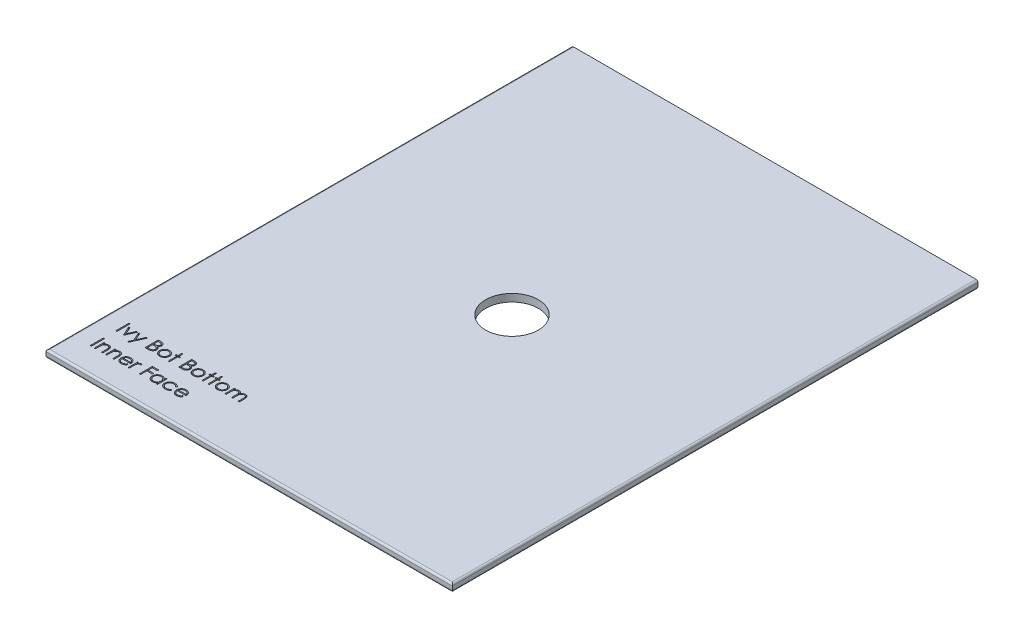
from build123d import *

# Parameters (mm, degrees)
SKETCH1_W           = 108
SKETCH1_H           = 139.75
BOSS_EXTRUDE1_DEPTH = 2
SKETCH6_R           = 7
CUT_EXTRUDE1_DEPTH  = 89.331849437
FILLET1_R           = 0.5
SKETCH9_W           = 0.314102564
SKETCH9_H           = 3.5
CUT_EXTRUDE4_DEPTH  = 1
CUT_EXTRUDE5_DEPTH  = 1


with BuildPart() as part:
    # Sketch1 → Boss-Extrude1 (new body)
    with BuildSketch(Plane(origin=(0, 0, 0), x_dir=(1, 0, 0), z_dir=(0, 1, 0))):
        Rectangle(SKETCH1_W, SKETCH1_H)
    extrude(amount=BOSS_EXTRUDE1_DEPTH)

    # Sketch6 → Cut-Extrude1 (cut, through all)
    with BuildSketch(Plane(origin=(0, 2, 0), x_dir=(1, 0, 0), z_dir=(0, 1, 0))):
        Circle(SKETCH6_R)
    extrude(amount=-CUT_EXTRUDE1_DEPTH, mode=Mode.SUBTRACT)

    # Fillet1
    fillet1_edges = [part.edges().sort_by_distance(p)[0] for p in [
        (-54, 0, 0),
        (0, 0, -69.875),
        (0, 0, 69.875),
        (54, 0, 0),
        (54, 2, 0),
        (-54, 2, 0),
        (0, 2, 69.875),
    ]]
    fillet(fillet1_edges, radius=FILLET1_R)

    # Sketch9 → Cut-Extrude4 (cut)
    # profile 1 of 21: a face of its own
    with BuildSketch(Plane(origin=(0, 2, 0), x_dir=(1, 0, 0), z_dir=(0, 1, 0))):
        with Locations((-48.84313938, -54.561589843)):
            Rectangle(SKETCH9_W, SKETCH9_H)
    # profile 2 of 21: a face of its own
    with BuildSketch(Plane(origin=(0, 2, 0), x_dir=(1, 0, 0), z_dir=(0, 1, 0))):
        Polygon((-48.147626559, -53.753897536), (-47.807582489, -53.753897536), (-46.958523995, -55.616077023), (-46.109465501, -53.753897536), (-45.769421431, -53.753897536), (-46.936088098, -56.311589843), (-46.980959892, -56.311589843), align=None)
    # profile 3 of 21: a face of its own
    with BuildSketch(Plane(origin=(0, 2, 0), x_dir=(1, 0, 0), z_dir=(0, 1, 0))):
        Polygon((-45.500190662, -53.753897536), (-45.161548835, -53.753897536), (-44.295663418, -55.712831831), (-43.416456687, -53.753897536), (-43.077113739, -53.753897536), (-44.647626559, -57.253897536), (-44.986969508, -57.253897536), (-44.466036014, -56.093540965), align=None)
    # profile 4 of 21: a face of its own
    with BuildSketch(Plane(origin=(0, 2, 0), x_dir=(1, 0, 0), z_dir=(0, 1, 0))):
        with BuildLine():
            Line((-41.237370149, -52.811589843), (-40.554477521, -52.811589843))
            add(Edge.make_bspline(
                [(-40.554477521, -52.811589843), (-40.521049042, -52.811765594), (-40.456256332, -52.812106242), (-40.36203689, -52.817389373), (-40.27378808, -52.824593043), (-40.191484307, -52.836023136), (-40.115163605, -52.849814913), (-40.044595968, -52.866516729), (-39.980005795, -52.886543342), (-39.902893059, -52.918389624), (-39.814972398, -52.965712792), (-39.719774005, -53.035641357), (-39.638369766, -53.12117382), (-39.568183449, -53.217656476), (-39.512382329, -53.323792247), (-39.472013032, -53.437051436), (-39.446455157, -53.555973178), (-39.443826722, -53.637616356), (-39.442498354, -53.678877504)],
                knots=[0, 0, 0, 0, 1.001505555, 1.941167018, 2.826882275, 3.653841531, 4.429895133, 5.150066043, 5.825578002, 6.45369114, 7.647487171, 8.808567382, 9.977351308, 11.170798116, 12.373658725, 13.556498008, 14.765093433, 16, 16, 16, 16], degree=3))
            add(Edge.make_bspline(
                [(-39.442498354, -53.678877504), (-39.443591572, -53.717530059), (-39.44573985, -53.793485976), (-39.466282609, -53.904580086), (-39.498443278, -54.010331304), (-39.543148527, -54.11035369), (-39.601250523, -54.202387303), (-39.670108842, -54.287174569), (-39.753185644, -54.361125626), (-39.815428884, -54.402468529), (-39.84704563, -54.42346885)],
                knots=[0, 0, 0, 0, 1.044552857, 2.05264487, 3.044412934, 4.028983338, 5.005914585, 5.980388656, 6.974128949, 8, 8, 8, 8], degree=3))
            add(Edge.make_bspline(
                [(-39.84704563, -54.42346885), (-39.807285202, -54.438733849), (-39.731213655, -54.467939573), (-39.626527642, -54.519575037), (-39.536332797, -54.575737148), (-39.459935651, -54.637068998), (-39.394597996, -54.703177808), (-39.337545055, -54.775032923), (-39.288863681, -54.853571681), (-39.247150757, -54.937975216), (-39.214602001, -55.027381684), (-39.190226097, -55.12095246), (-39.176258648, -55.218352016), (-39.174271006, -55.284637395), (-39.173267585, -55.31810026)],
                knots=[0, 0, 0, 0, 1.27268992, 2.434971085, 3.483601985, 4.442670788, 5.356604649, 6.2567628, 7.179492994, 8.113709626, 9.066344395, 10.018646069, 10.999752585, 12, 12, 12, 12], degree=3))
            add(Edge.make_bspline(
                [(-39.173267585, -55.31810026), (-39.174244431, -55.352267132), (-39.176166403, -55.41949141), (-39.190346375, -55.518246545), (-39.214355481, -55.612621491), (-39.247426628, -55.703226674), (-39.290588942, -55.789886809), (-39.343116907, -55.872700073), (-39.40574847, -55.950834403), (-39.475811339, -56.025158026), (-39.555073485, -56.091985814), (-39.64058924, -56.15150152), (-39.73343556, -56.200447582), (-39.832087554, -56.241563604), (-39.93765187, -56.272970802), (-40.049654477, -56.294943376), (-40.167998779, -56.309748413), (-40.24920853, -56.310965618), (-40.290855726, -56.311589843)],
                knots=[0, 0, 0, 0, 0.978564426, 1.925352924, 2.850884081, 3.763762016, 4.682927383, 5.618979971, 6.567305752, 7.547517671, 8.540179244, 9.531824382, 10.526200242, 11.540722885, 12.589160233, 13.674978461, 14.80764778, 16, 16, 16, 16], degree=3))
            Line((-40.290855726, -56.311589843), (-41.237370149, -56.311589843))
            Line((-41.237370149, -56.311589843), (-41.237370149, -52.811589843))
        make_face()
        with BuildLine():
            Line((-40.923267585, -53.170564202), (-40.923267585, -54.292359074))
            Line((-40.923267585, -54.292359074), (-40.712229925, -54.292359074))
            add(Edge.make_bspline(
                [(-40.712229925, -54.292359074), (-40.681381129, -54.291959151), (-40.62177497, -54.291186418), (-40.535455073, -54.288972901), (-40.455330055, -54.282774858), (-40.381538222, -54.276578596), (-40.314195778, -54.266504008), (-40.253451917, -54.254511885), (-40.19835332, -54.24182898), (-40.134813774, -54.220259493), (-40.062740826, -54.188381818), (-39.985907722, -54.138909982), (-39.918173252, -54.079985629), (-39.860976064, -54.011994667), (-39.814164594, -53.937128481), (-39.781650879, -53.856581601), (-39.759603594, -53.772361469), (-39.757612063, -53.714543216), (-39.756600918, -53.6851876)],
                knots=[0, 0, 0, 0, 1.156816544, 2.235205308, 3.236616184, 4.169592532, 5.011045266, 5.787822928, 6.49130361, 7.128639758, 8.301311294, 9.436451833, 10.541879658, 11.654887649, 12.756523258, 13.837046038, 14.901820046, 16, 16, 16, 16], degree=3))
            add(Edge.make_bspline(
                [(-39.756600918, -53.6851876), (-39.757127098, -53.665761828), (-39.758159258, -53.627656056), (-39.766612561, -53.572106702), (-39.780980135, -53.51986295), (-39.799434428, -53.470208839), (-39.825223117, -53.424696989), (-39.85558658, -53.381753793), (-39.892272271, -53.342841675), (-39.934029583, -53.306472176), (-39.982038206, -53.274227649), (-40.036269498, -53.245986886), (-40.097457175, -53.223246109), (-40.16457003, -53.203329956), (-40.238641118, -53.189341663), (-40.318815671, -53.177688275), (-40.40575039, -53.171755533), (-40.465895493, -53.17097017), (-40.496985533, -53.170564202)],
                knots=[0, 0, 0, 0, 0.91205012, 1.789085906, 2.630437955, 3.453916878, 4.269457761, 5.079663411, 5.91843418, 6.774407191, 7.675494373, 8.627863946, 9.638891023, 10.736472738, 11.911756761, 13.175263542, 14.539845004, 16, 16, 16, 16], degree=3))
            Line((-40.496985533, -53.170564202), (-40.923267585, -53.170564202))
        make_face(mode=Mode.SUBTRACT)
        with BuildLine():
            Line((-40.923267585, -54.651333433), (-40.923267585, -55.952615484))
            Line((-40.923267585, -55.952615484), (-40.47595188, -55.952615484))
            add(Edge.make_bspline(
                [(-40.47595188, -55.952615484), (-40.443932954, -55.952231737), (-40.382220695, -55.951492115), (-40.293119465, -55.94907756), (-40.210536361, -55.943585284), (-40.134848226, -55.934939435), (-40.065237773, -55.925560985), (-40.00254007, -55.912949705), (-39.946246876, -55.898500744), (-39.880972569, -55.876166572), (-39.80746906, -55.841470101), (-39.728258204, -55.789155874), (-39.657831986, -55.726832567), (-39.598026727, -55.654701652), (-39.549013738, -55.576270326), (-39.513358283, -55.493124976), (-39.491367426, -55.406639448), (-39.488705257, -55.347672736), (-39.487370149, -55.31810026)],
                knots=[0, 0, 0, 0, 1.160039823, 2.235823828, 3.228722157, 4.157150951, 4.99529583, 5.772374946, 6.472645482, 7.099169577, 8.269452708, 9.405989375, 10.527446681, 11.663510218, 12.788923519, 13.866172445, 14.929861265, 16, 16, 16, 16], degree=3))
            add(Edge.make_bspline(
                [(-39.487370149, -55.31810026), (-39.487646253, -55.29960692), (-39.488194008, -55.262918538), (-39.496454623, -55.209002719), (-39.508468493, -55.156776845), (-39.523999927, -55.106099105), (-39.546619394, -55.057885728), (-39.573025939, -55.011183169), (-39.603987341, -54.965929689), (-39.652231507, -54.908717436), (-39.722403491, -54.842800423), (-39.822110266, -54.778262921), (-39.935482564, -54.726215114), (-40.017710057, -54.704115637), (-40.060186655, -54.692699619)],
                knots=[0, 0, 0, 0, 0.723448775, 1.435228256, 2.130040452, 2.821711965, 3.505591119, 4.210454504, 4.921174351, 5.648778258, 7.137944449, 8.670945889, 10.280296675, 12, 12, 12, 12], degree=3))
            add(Edge.make_bspline(
                [(-40.060186655, -54.692699619), (-40.077215751, -54.689244535), (-40.114138343, -54.6817532), (-40.174345924, -54.673845497), (-40.243081793, -54.666800437), (-40.32050467, -54.661589279), (-40.406712511, -54.656202736), (-40.50188943, -54.654107915), (-40.605646745, -54.651608655), (-40.677639117, -54.65142752), (-40.715034412, -54.651333433)],
                knots=[0, 0, 0, 0, 0.634451884, 1.375622551, 2.216452059, 3.157844607, 4.20941857, 5.370758133, 6.634282058, 8, 8, 8, 8], degree=3))
            Line((-40.715034412, -54.651333433), (-40.923267585, -54.651333433))
        make_face(mode=Mode.SUBTRACT)
    # profile 5 of 21: a face of its own
    with BuildSketch(Plane(origin=(0, 2, 0), x_dir=(1, 0, 0), z_dir=(0, 1, 0))):
        with BuildLine():
            add(Edge.make_bspline(
                [(-37.309685854, -53.709025741), (-37.261694581, -53.710047632), (-37.167595424, -53.712051311), (-37.029787538, -53.733466276), (-36.898242402, -53.766213641), (-36.77245621, -53.811485203), (-36.654039914, -53.872167153), (-36.54126867, -53.944576445), (-36.434451661, -54.030359038), (-36.370428632, -54.096717106), (-36.337931046, -54.13039994)],
                knots=[0, 0, 0, 0, 1.054011418, 2.066658804, 3.057071809, 4.030435133, 4.997543892, 5.974964718, 6.972108034, 8, 8, 8, 8], degree=3))
            add(Edge.make_bspline(
                [(-36.337931046, -54.13039994), (-36.309949092, -54.162613925), (-36.254526712, -54.226418468), (-36.183460993, -54.329874081), (-36.122239433, -54.437014181), (-36.073176472, -54.549261508), (-36.034491448, -54.665636179), (-36.007025752, -54.78653819), (-35.990688817, -54.911700537), (-35.98848585, -54.996704375), (-35.987370149, -55.039754908)],
                knots=[0, 0, 0, 0, 1.025258237, 2.030674902, 3.01204498, 3.988269485, 4.97094183, 5.956517959, 6.965070386, 8, 8, 8, 8], degree=3))
            add(Edge.make_bspline(
                [(-35.987370149, -55.039754908), (-35.988351486, -55.083054965), (-35.990290654, -55.168617899), (-36.008634271, -55.294637264), (-36.037165357, -55.416832087), (-36.077997195, -55.534690781), (-36.130355304, -55.648573608), (-36.194245992, -55.757983157), (-36.270117609, -55.863135291), (-36.356121606, -55.963137129), (-36.451173482, -56.055303344), (-36.55428963, -56.135631613), (-36.663443664, -56.204453138), (-36.780087017, -56.259889553), (-36.903154504, -56.303599254), (-37.032911572, -56.33429927), (-37.169156642, -56.352860954), (-37.262183864, -56.355244527), (-37.309685854, -56.356461638)],
                knots=[0, 0, 0, 0, 0.998656419, 1.973391657, 2.932242238, 3.890759089, 4.846373663, 5.82037756, 6.809684879, 7.83454468, 8.860553229, 9.859544525, 10.845671541, 11.83227036, 12.833544569, 13.85385346, 14.904124723, 16, 16, 16, 16], degree=3))
            add(Edge.make_bspline(
                [(-37.309685854, -56.356461638), (-37.357420574, -56.355240442), (-37.450911433, -56.352848668), (-37.587637415, -56.334371385), (-37.717627034, -56.303613402), (-37.840855633, -56.25974591), (-37.95800048, -56.204451366), (-38.067786977, -56.135839676), (-38.170986892, -56.055279521), (-38.266058876, -55.963143584), (-38.352057482, -55.863133628), (-38.42793049, -55.757983589), (-38.491820816, -55.648573496), (-38.54417902, -55.534690811), (-38.585010833, -55.416832079), (-38.613541926, -55.294637266), (-38.63188554, -55.168617898), (-38.633824709, -55.083054965), (-38.634806046, -55.039754908)],
                knots=[0, 0, 0, 0, 1.099876186, 2.154163076, 3.173186993, 4.173200201, 5.163417411, 6.152872554, 7.150605724, 8.17532212, 9.198891216, 10.186952605, 11.159729845, 12.11414092, 13.071450619, 14.029093627, 15.002601286, 16, 16, 16, 16], degree=3))
            add(Edge.make_bspline(
                [(-38.634806046, -55.039754908), (-38.633682736, -54.996938362), (-38.631458775, -54.912168959), (-38.615138265, -54.787241899), (-38.587779709, -54.66654451), (-38.549048312, -54.550619034), (-38.499533122, -54.438863597), (-38.439171834, -54.331458766), (-38.367381201, -54.228470966), (-38.31217925, -54.164748886), (-38.284245149, -54.132503305)],
                knots=[0, 0, 0, 0, 1.031353054, 2.041901799, 3.029428768, 4.008703097, 4.981709435, 5.96992636, 6.972712378, 8, 8, 8, 8], degree=3))
            add(Edge.make_bspline(
                [(-38.284245149, -54.132503305), (-38.251796558, -54.098528366), (-38.187980694, -54.031710669), (-38.080631966, -53.946178145), (-37.968138145, -53.872262072), (-37.848413219, -53.812785856), (-37.722730361, -53.765947338), (-37.590511119, -53.733381823), (-37.452235603, -53.712128468), (-37.357675982, -53.71007029), (-37.309685854, -53.709025741)],
                knots=[0, 0, 0, 0, 1.027980169, 2.021703884, 2.998553061, 3.971491411, 4.943284454, 5.930300938, 6.949603206, 8, 8, 8, 8], degree=3))
        make_face()
        with BuildLine():
            add(Edge.make_bspline(
                [(-37.311088098, -54.023128305), (-37.345025709, -54.024092897), (-37.412024838, -54.025997179), (-37.510644422, -54.040481084), (-37.605584576, -54.063428588), (-37.69702542, -54.096032644), (-37.784658593, -54.138131543), (-37.868567995, -54.189839903), (-37.949000435, -54.25047286), (-38.024382498, -54.319935531), (-38.093564811, -54.395814526), (-38.154042787, -54.476662885), (-38.205467894, -54.561169231), (-38.248308053, -54.649421442), (-38.280215241, -54.742313856), (-38.303388263, -54.838794487), (-38.317858504, -54.939059904), (-38.319744882, -55.007220922), (-38.320703482, -55.041858273)],
                knots=[0, 0, 0, 0, 1.021534396, 2.016698045, 2.994645724, 3.958388632, 4.93408049, 5.916473867, 6.921342795, 7.962252576, 8.998418191, 10.008913653, 10.997312074, 11.973003931, 12.956656626, 13.948281152, 14.957379055, 16, 16, 16, 16], degree=3))
            add(Edge.make_bspline(
                [(-38.320703482, -55.041858273), (-38.319096659, -55.0866103), (-38.315907414, -55.175434706), (-38.289972178, -55.306245828), (-38.246585898, -55.43182768), (-38.187998618, -55.551444066), (-38.114592399, -55.662116344), (-38.028105333, -55.760787829), (-37.929465632, -55.84597364), (-37.819849132, -55.916654486), (-37.701494814, -55.972814241), (-37.576238493, -56.012613217), (-37.445597799, -56.03848491), (-37.356317068, -56.041056384), (-37.311088098, -56.042359074)],
                knots=[0, 0, 0, 0, 1.016792936, 2.018143844, 3.017858371, 4.030088057, 5.03801393, 6.028138512, 7.003788237, 7.991172063, 8.984598303, 9.972568034, 10.972917682, 12, 12, 12, 12], degree=3))
            add(Edge.make_bspline(
                [(-37.311088098, -56.042359074), (-37.265861729, -56.041048794), (-37.176586133, -56.038462337), (-37.046126956, -56.012743517), (-36.921212984, -55.972639857), (-36.802981596, -55.916717647), (-36.693414993, -55.845705232), (-36.594065872, -55.761268855), (-36.508317261, -55.661855004), (-36.434983656, -55.551297475), (-36.375436913, -55.432013123), (-36.332253711, -55.30622265), (-36.306256125, -55.175440608), (-36.303075297, -55.086612278), (-36.301472713, -55.041858273)],
                knots=[0, 0, 0, 0, 1.02726834, 2.027799167, 3.010890988, 4.004497153, 4.992059811, 5.971914811, 6.958719428, 7.966827853, 8.981595046, 9.981490638, 10.983022906, 12, 12, 12, 12], degree=3))
            add(Edge.make_bspline(
                [(-36.301472713, -55.041858273), (-36.302430983, -55.007220715), (-36.304316712, -54.93905929), (-36.318791676, -54.838796836), (-36.341947216, -54.742305239), (-36.373918833, -54.649453236), (-36.416572847, -54.560940732), (-36.46898964, -54.476911005), (-36.529220666, -54.395534459), (-36.599237787, -54.320180818), (-36.674541165, -54.250445781), (-36.755006203, -54.189816392), (-36.838791181, -54.138358796), (-36.926169764, -54.095672556), (-37.017622332, -54.063725215), (-37.112429461, -54.040348584), (-37.210628271, -54.026058387), (-37.277387314, -54.024111246), (-37.311088098, -54.023128305)],
                knots=[0, 0, 0, 0, 1.042956736, 2.052379634, 3.044323526, 4.02829302, 5.004299113, 5.996692471, 7.007513377, 8.048758398, 9.090003419, 10.095195979, 11.07790575, 12.047570684, 13.018257071, 13.989683339, 14.985167495, 16, 16, 16, 16], degree=3))
        make_face(mode=Mode.SUBTRACT)
    # profile 6 of 21: a face of its own
    with BuildSketch(Plane(origin=(0, 2, 0), x_dir=(1, 0, 0), z_dir=(0, 1, 0))):
        Polygon((-35.045062457, -52.721846254), (-34.730959892, -52.721846254), (-34.730959892, -53.753897536), (-34.282241944, -53.753897536), (-34.282241944, -54.0680001), (-34.730959892, -54.0680001), (-34.730959892, -56.311589843), (-35.045062457, -56.311589843), (-35.045062457, -54.0680001), (-35.493780405, -54.0680001), (-35.493780405, -53.753897536), (-35.045062457, -53.753897536), align=None)
    # profile 7 of 21: a face of its own
    with BuildSketch(Plane(origin=(0, 2, 0), x_dir=(1, 0, 0), z_dir=(0, 1, 0))):
        with BuildLine():
            Line((-32.307882969, -52.811589843), (-31.624990341, -52.811589843))
            add(Edge.make_bspline(
                [(-31.624990341, -52.811589843), (-31.591561863, -52.811765594), (-31.526769153, -52.812106242), (-31.432549711, -52.817389373), (-31.3443009, -52.824593043), (-31.261997128, -52.836023136), (-31.185676425, -52.849814913), (-31.115108788, -52.866516729), (-31.050518616, -52.886543342), (-30.97340588, -52.918389624), (-30.885485219, -52.965712792), (-30.790286826, -53.035641357), (-30.708882587, -53.12117382), (-30.638696269, -53.217656476), (-30.58289515, -53.323792247), (-30.542525852, -53.437051436), (-30.516967977, -53.555973178), (-30.514339543, -53.637616356), (-30.513011175, -53.678877504)],
                knots=[0, 0, 0, 0, 1.001505555, 1.941167018, 2.826882275, 3.653841531, 4.429895133, 5.150066043, 5.825578002, 6.45369114, 7.647487171, 8.808567382, 9.977351308, 11.170798116, 12.373658725, 13.556498008, 14.765093433, 16, 16, 16, 16], degree=3))
            add(Edge.make_bspline(
                [(-30.513011175, -53.678877504), (-30.514104393, -53.717530059), (-30.51625267, -53.793485976), (-30.53679543, -53.904580086), (-30.568956098, -54.010331304), (-30.613661347, -54.11035369), (-30.671763343, -54.202387303), (-30.740621662, -54.287174569), (-30.823698465, -54.361125626), (-30.885941705, -54.402468529), (-30.91755845, -54.42346885)],
                knots=[0, 0, 0, 0, 1.044552857, 2.05264487, 3.044412934, 4.028983338, 5.005914585, 5.980388656, 6.974128949, 8, 8, 8, 8], degree=3))
            add(Edge.make_bspline(
                [(-30.91755845, -54.42346885), (-30.877798023, -54.438733849), (-30.801726475, -54.467939573), (-30.697040463, -54.519575037), (-30.606845618, -54.575737148), (-30.530448472, -54.637068998), (-30.465110817, -54.703177808), (-30.408057875, -54.775032923), (-30.359376501, -54.853571681), (-30.317663578, -54.937975216), (-30.285114822, -55.027381684), (-30.260738917, -55.12095246), (-30.246771468, -55.218352016), (-30.244783827, -55.284637395), (-30.243780405, -55.31810026)],
                knots=[0, 0, 0, 0, 1.27268992, 2.434971085, 3.483601985, 4.442670788, 5.356604649, 6.2567628, 7.179492994, 8.113709626, 9.066344395, 10.018646069, 10.999752585, 12, 12, 12, 12], degree=3))
            add(Edge.make_bspline(
                [(-30.243780405, -55.31810026), (-30.244757251, -55.352267132), (-30.246679223, -55.41949141), (-30.260859195, -55.518246545), (-30.284868302, -55.612621491), (-30.317939448, -55.703226674), (-30.361101763, -55.789886809), (-30.413629727, -55.872700073), (-30.476261291, -55.950834403), (-30.54632416, -56.025158026), (-30.625586305, -56.091985814), (-30.71110206, -56.15150152), (-30.80394838, -56.200447582), (-30.902600374, -56.241563604), (-31.00816469, -56.272970802), (-31.120167298, -56.294943376), (-31.2385116, -56.309748413), (-31.319721351, -56.310965618), (-31.361368546, -56.311589843)],
                knots=[0, 0, 0, 0, 0.978564426, 1.925352924, 2.850884081, 3.763762016, 4.682927383, 5.618979971, 6.567305752, 7.547517671, 8.540179244, 9.531824382, 10.526200242, 11.540722885, 12.589160233, 13.674978461, 14.80764778, 16, 16, 16, 16], degree=3))
            Line((-31.361368546, -56.311589843), (-32.307882969, -56.311589843))
            Line((-32.307882969, -56.311589843), (-32.307882969, -52.811589843))
        make_face()
        with BuildLine():
            Line((-31.993780405, -53.170564202), (-31.993780405, -54.292359074))
            Line((-31.993780405, -54.292359074), (-31.782742745, -54.292359074))
            add(Edge.make_bspline(
                [(-31.782742745, -54.292359074), (-31.75189395, -54.291959151), (-31.69228779, -54.291186418), (-31.605967894, -54.288972901), (-31.525842876, -54.282774858), (-31.452051043, -54.276578596), (-31.384708599, -54.266504008), (-31.323964737, -54.254511885), (-31.26886614, -54.24182898), (-31.205326595, -54.220259493), (-31.133253646, -54.188381818), (-31.056420542, -54.138909982), (-30.988686072, -54.079985629), (-30.931488885, -54.011994667), (-30.884677414, -53.937128481), (-30.852163699, -53.856581601), (-30.830116415, -53.772361469), (-30.828124883, -53.714543216), (-30.827113739, -53.6851876)],
                knots=[0, 0, 0, 0, 1.156816544, 2.235205308, 3.236616184, 4.169592532, 5.011045266, 5.787822928, 6.49130361, 7.128639758, 8.301311294, 9.436451833, 10.541879658, 11.654887649, 12.756523258, 13.837046038, 14.901820046, 16, 16, 16, 16], degree=3))
            add(Edge.make_bspline(
                [(-30.827113739, -53.6851876), (-30.827639919, -53.665761828), (-30.828672079, -53.627656056), (-30.837125381, -53.572106702), (-30.851492956, -53.51986295), (-30.869947249, -53.470208839), (-30.895735938, -53.424696989), (-30.926099401, -53.381753793), (-30.962785091, -53.342841675), (-31.004542404, -53.306472176), (-31.052551027, -53.274227649), (-31.106782319, -53.245986886), (-31.167969996, -53.223246109), (-31.235082851, -53.203329956), (-31.309153938, -53.189341663), (-31.389328492, -53.177688275), (-31.476263211, -53.171755533), (-31.536408313, -53.17097017), (-31.567498354, -53.170564202)],
                knots=[0, 0, 0, 0, 0.91205012, 1.789085906, 2.630437955, 3.453916878, 4.269457761, 5.079663411, 5.91843418, 6.774407191, 7.675494373, 8.627863946, 9.638891023, 10.736472738, 11.911756761, 13.175263542, 14.539845004, 16, 16, 16, 16], degree=3))
            Line((-31.567498354, -53.170564202), (-31.993780405, -53.170564202))
        make_face(mode=Mode.SUBTRACT)
        with BuildLine():
            Line((-31.993780405, -54.651333433), (-31.993780405, -55.952615484))
            Line((-31.993780405, -55.952615484), (-31.5464647, -55.952615484))
            add(Edge.make_bspline(
                [(-31.5464647, -55.952615484), (-31.514445774, -55.952231737), (-31.452733516, -55.951492115), (-31.363632286, -55.94907756), (-31.281049182, -55.943585284), (-31.205361046, -55.934939435), (-31.135750593, -55.925560985), (-31.07305289, -55.912949705), (-31.016759697, -55.898500744), (-30.951485389, -55.876166572), (-30.877981881, -55.841470101), (-30.798771024, -55.789155874), (-30.728344806, -55.726832567), (-30.668539547, -55.654701652), (-30.619526559, -55.576270326), (-30.583871104, -55.493124976), (-30.561880247, -55.406639448), (-30.559218077, -55.347672736), (-30.557882969, -55.31810026)],
                knots=[0, 0, 0, 0, 1.160039823, 2.235823828, 3.228722157, 4.157150951, 4.99529583, 5.772374946, 6.472645482, 7.099169577, 8.269452708, 9.405989375, 10.527446681, 11.663510218, 12.788923519, 13.866172445, 14.929861265, 16, 16, 16, 16], degree=3))
            add(Edge.make_bspline(
                [(-30.557882969, -55.31810026), (-30.558159074, -55.29960692), (-30.558706829, -55.262918538), (-30.566967444, -55.209002719), (-30.578981314, -55.156776845), (-30.594512747, -55.106099105), (-30.617132215, -55.057885728), (-30.64353876, -55.011183169), (-30.674500161, -54.965929689), (-30.722744327, -54.908717436), (-30.792916312, -54.842800423), (-30.892623087, -54.778262921), (-31.005995385, -54.726215114), (-31.088222878, -54.704115637), (-31.130699476, -54.692699619)],
                knots=[0, 0, 0, 0, 0.723448775, 1.435228256, 2.130040452, 2.821711965, 3.505591119, 4.210454504, 4.921174351, 5.648778258, 7.137944449, 8.670945889, 10.280296675, 12, 12, 12, 12], degree=3))
            add(Edge.make_bspline(
                [(-31.130699476, -54.692699619), (-31.147728572, -54.689244535), (-31.184651164, -54.6817532), (-31.244858744, -54.673845497), (-31.313594613, -54.666800437), (-31.391017491, -54.661589279), (-31.477225332, -54.656202736), (-31.57240225, -54.654107915), (-31.676159565, -54.651608655), (-31.748151937, -54.65142752), (-31.785547232, -54.651333433)],
                knots=[0, 0, 0, 0, 0.634451884, 1.375622551, 2.216452059, 3.157844607, 4.20941857, 5.370758133, 6.634282058, 8, 8, 8, 8], degree=3))
            Line((-31.785547232, -54.651333433), (-31.993780405, -54.651333433))
        make_face(mode=Mode.SUBTRACT)
    # profile 8 of 21: a face of its own
    with BuildSketch(Plane(origin=(0, 2, 0), x_dir=(1, 0, 0), z_dir=(0, 1, 0))):
        with BuildLine():
            add(Edge.make_bspline(
                [(-28.380198675, -53.709025741), (-28.332207402, -53.710047632), (-28.238108244, -53.712051311), (-28.100300358, -53.733466276), (-27.968755222, -53.766213641), (-27.84296903, -53.811485203), (-27.724552735, -53.872167153), (-27.611781491, -53.944576445), (-27.504964482, -54.030359038), (-27.440941452, -54.096717106), (-27.408443867, -54.13039994)],
                knots=[0, 0, 0, 0, 1.054011418, 2.066658804, 3.057071809, 4.030435133, 4.997543892, 5.974964718, 6.972108034, 8, 8, 8, 8], degree=3))
            add(Edge.make_bspline(
                [(-27.408443867, -54.13039994), (-27.380461913, -54.162613925), (-27.325039533, -54.226418468), (-27.253973814, -54.329874081), (-27.192752254, -54.437014181), (-27.143689293, -54.549261508), (-27.105004269, -54.665636179), (-27.077538573, -54.78653819), (-27.061201638, -54.911700537), (-27.058998671, -54.996704375), (-27.057882969, -55.039754908)],
                knots=[0, 0, 0, 0, 1.025258237, 2.030674902, 3.01204498, 3.988269485, 4.97094183, 5.956517959, 6.965070386, 8, 8, 8, 8], degree=3))
            add(Edge.make_bspline(
                [(-27.057882969, -55.039754908), (-27.058864307, -55.083054965), (-27.060803475, -55.168617899), (-27.079147091, -55.294637264), (-27.107678177, -55.416832087), (-27.148510015, -55.534690781), (-27.200868125, -55.648573608), (-27.264758812, -55.757983157), (-27.340630429, -55.863135291), (-27.426634426, -55.963137129), (-27.521686302, -56.055303344), (-27.624802451, -56.135631613), (-27.733956484, -56.204453138), (-27.850599838, -56.259889553), (-27.973667324, -56.303599254), (-28.103424393, -56.33429927), (-28.239669463, -56.352860954), (-28.332696684, -56.355244527), (-28.380198675, -56.356461638)],
                knots=[0, 0, 0, 0, 0.998656419, 1.973391657, 2.932242238, 3.890759089, 4.846373663, 5.82037756, 6.809684879, 7.83454468, 8.860553229, 9.859544525, 10.845671541, 11.83227036, 12.833544569, 13.85385346, 14.904124723, 16, 16, 16, 16], degree=3))
            add(Edge.make_bspline(
                [(-28.380198675, -56.356461638), (-28.427933394, -56.355240442), (-28.521424254, -56.352848668), (-28.658150236, -56.334371385), (-28.788139855, -56.303613402), (-28.911368453, -56.25974591), (-29.0285133, -56.204451366), (-29.138299797, -56.135839676), (-29.241499713, -56.055279521), (-29.336571697, -55.963143584), (-29.422570302, -55.863133628), (-29.498443311, -55.757983589), (-29.562333637, -55.648573496), (-29.614691841, -55.534690811), (-29.655523654, -55.416832079), (-29.684054746, -55.294637266), (-29.702398361, -55.168617898), (-29.704337529, -55.083054965), (-29.705318867, -55.039754908)],
                knots=[0, 0, 0, 0, 1.099876186, 2.154163076, 3.173186993, 4.173200201, 5.163417411, 6.152872554, 7.150605724, 8.17532212, 9.198891216, 10.186952605, 11.159729845, 12.11414092, 13.071450619, 14.029093627, 15.002601286, 16, 16, 16, 16], degree=3))
            add(Edge.make_bspline(
                [(-29.705318867, -55.039754908), (-29.704195556, -54.996938362), (-29.701971595, -54.912168959), (-29.685651086, -54.787241899), (-29.658292529, -54.66654451), (-29.619561133, -54.550619034), (-29.570045942, -54.438863597), (-29.509684654, -54.331458766), (-29.437894022, -54.228470966), (-29.38269207, -54.164748886), (-29.354757969, -54.132503305)],
                knots=[0, 0, 0, 0, 1.031353054, 2.041901799, 3.029428768, 4.008703097, 4.981709435, 5.96992636, 6.972712378, 8, 8, 8, 8], degree=3))
            add(Edge.make_bspline(
                [(-29.354757969, -54.132503305), (-29.322309378, -54.098528366), (-29.258493515, -54.031710669), (-29.151144787, -53.946178145), (-29.038650966, -53.872262072), (-28.91892604, -53.812785856), (-28.793243182, -53.765947338), (-28.661023939, -53.733381823), (-28.522748424, -53.712128468), (-28.428188802, -53.71007029), (-28.380198675, -53.709025741)],
                knots=[0, 0, 0, 0, 1.027980169, 2.021703884, 2.998553061, 3.971491411, 4.943284454, 5.930300938, 6.949603206, 8, 8, 8, 8], degree=3))
        make_face()
        with BuildLine():
            add(Edge.make_bspline(
                [(-28.381600918, -54.023128305), (-28.415538529, -54.024092897), (-28.482537658, -54.025997179), (-28.581157243, -54.040481084), (-28.676097397, -54.063428588), (-28.767538241, -54.096032644), (-28.855171413, -54.138131543), (-28.939080816, -54.189839903), (-29.019513256, -54.25047286), (-29.094895319, -54.319935531), (-29.164077631, -54.395814526), (-29.224555608, -54.476662885), (-29.275980714, -54.561169231), (-29.318820873, -54.649421442), (-29.350728061, -54.742313856), (-29.373901084, -54.838794487), (-29.388371324, -54.939059904), (-29.390257703, -55.007220922), (-29.391216303, -55.041858273)],
                knots=[0, 0, 0, 0, 1.021534396, 2.016698045, 2.994645724, 3.958388632, 4.93408049, 5.916473867, 6.921342795, 7.962252576, 8.998418191, 10.008913653, 10.997312074, 11.973003931, 12.956656626, 13.948281152, 14.957379055, 16, 16, 16, 16], degree=3))
            add(Edge.make_bspline(
                [(-29.391216303, -55.041858273), (-29.389609479, -55.0866103), (-29.386420235, -55.175434706), (-29.360484998, -55.306245828), (-29.317098718, -55.43182768), (-29.258511439, -55.551444066), (-29.18510522, -55.662116344), (-29.098618153, -55.760787829), (-28.999978453, -55.84597364), (-28.890361953, -55.916654486), (-28.772007635, -55.972814241), (-28.646751314, -56.012613217), (-28.51611062, -56.03848491), (-28.426829888, -56.041056384), (-28.381600918, -56.042359074)],
                knots=[0, 0, 0, 0, 1.016792936, 2.018143844, 3.017858371, 4.030088057, 5.03801393, 6.028138512, 7.003788237, 7.991172063, 8.984598303, 9.972568034, 10.972917682, 12, 12, 12, 12], degree=3))
            add(Edge.make_bspline(
                [(-28.381600918, -56.042359074), (-28.336374549, -56.041048794), (-28.247098953, -56.038462337), (-28.116639776, -56.012743517), (-27.991725804, -55.972639857), (-27.873494417, -55.916717647), (-27.763927814, -55.845705232), (-27.664578692, -55.761268855), (-27.578830081, -55.661855004), (-27.505496476, -55.551297475), (-27.445949733, -55.432013123), (-27.402766532, -55.30622265), (-27.376768946, -55.175440608), (-27.373588117, -55.086612278), (-27.371985533, -55.041858273)],
                knots=[0, 0, 0, 0, 1.02726834, 2.027799167, 3.010890988, 4.004497153, 4.992059811, 5.971914811, 6.958719428, 7.966827853, 8.981595046, 9.981490638, 10.983022906, 12, 12, 12, 12], degree=3))
            add(Edge.make_bspline(
                [(-27.371985533, -55.041858273), (-27.372943804, -55.007220715), (-27.374829533, -54.93905929), (-27.389304497, -54.838796836), (-27.412460037, -54.742305239), (-27.444431654, -54.649453236), (-27.487085668, -54.560940732), (-27.539502461, -54.476911005), (-27.599733486, -54.395534459), (-27.669750607, -54.320180818), (-27.745053985, -54.250445781), (-27.825519023, -54.189816392), (-27.909304002, -54.138358796), (-27.996682584, -54.095672556), (-28.088135152, -54.063725215), (-28.182942281, -54.040348584), (-28.281141091, -54.026058387), (-28.347900134, -54.024111246), (-28.381600918, -54.023128305)],
                knots=[0, 0, 0, 0, 1.042956736, 2.052379634, 3.044323526, 4.02829302, 5.004299113, 5.996692471, 7.007513377, 8.048758398, 9.090003419, 10.095195979, 11.07790575, 12.047570684, 13.018257071, 13.989683339, 14.985167495, 16, 16, 16, 16], degree=3))
        make_face(mode=Mode.SUBTRACT)
    # profile 9 of 21: a face of its own
    with BuildSketch(Plane(origin=(0, 2, 0), x_dir=(1, 0, 0), z_dir=(0, 1, 0))):
        Polygon((-26.115575277, -52.721846254), (-25.801472713, -52.721846254), (-25.801472713, -53.753897536), (-25.352754764, -53.753897536), (-25.352754764, -54.0680001), (-25.801472713, -54.0680001), (-25.801472713, -56.311589843), (-26.115575277, -56.311589843), (-26.115575277, -54.0680001), (-26.564293226, -54.0680001), (-26.564293226, -53.753897536), (-26.115575277, -53.753897536), align=None)
    # profile 10 of 21: a face of its own
    with BuildSketch(Plane(origin=(0, 2, 0), x_dir=(1, 0, 0), z_dir=(0, 1, 0))):
        Polygon((-24.500190662, -52.721846254), (-24.186088098, -52.721846254), (-24.186088098, -53.753897536), (-23.737370149, -53.753897536), (-23.737370149, -54.0680001), (-24.186088098, -54.0680001), (-24.186088098, -56.311589843), (-24.500190662, -56.311589843), (-24.500190662, -54.0680001), (-24.94890861, -54.0680001), (-24.94890861, -53.753897536), (-24.500190662, -53.753897536), align=None)
    # profile 11 of 21: a face of its own
    with BuildSketch(Plane(origin=(0, 2, 0), x_dir=(1, 0, 0), z_dir=(0, 1, 0))):
        with BuildLine():
            add(Edge.make_bspline(
                [(-21.963532008, -53.709025741), (-21.915540735, -53.710047632), (-21.821441577, -53.712051311), (-21.683633692, -53.733466276), (-21.552088556, -53.766213641), (-21.426302363, -53.811485203), (-21.307886068, -53.872167153), (-21.195114824, -53.944576445), (-21.088297815, -54.030359038), (-21.024274786, -54.096717106), (-20.9917772, -54.13039994)],
                knots=[0, 0, 0, 0, 1.054011418, 2.066658804, 3.057071809, 4.030435133, 4.997543892, 5.974964718, 6.972108034, 8, 8, 8, 8], degree=3))
            add(Edge.make_bspline(
                [(-20.9917772, -54.13039994), (-20.963795246, -54.162613925), (-20.908372866, -54.226418468), (-20.837307147, -54.329874081), (-20.776085587, -54.437014181), (-20.727022626, -54.549261508), (-20.688337602, -54.665636179), (-20.660871906, -54.78653819), (-20.644534971, -54.911700537), (-20.642332004, -54.996704375), (-20.641216303, -55.039754908)],
                knots=[0, 0, 0, 0, 1.025258237, 2.030674902, 3.01204498, 3.988269485, 4.97094183, 5.956517959, 6.965070386, 8, 8, 8, 8], degree=3))
            add(Edge.make_bspline(
                [(-20.641216303, -55.039754908), (-20.64219764, -55.083054965), (-20.644136808, -55.168617899), (-20.662480425, -55.294637264), (-20.691011511, -55.416832087), (-20.731843349, -55.534690781), (-20.784201458, -55.648573608), (-20.848092146, -55.757983157), (-20.923963763, -55.863135291), (-21.009967759, -55.963137129), (-21.105019636, -56.055303344), (-21.208135784, -56.135631613), (-21.317289818, -56.204453138), (-21.433933171, -56.259889553), (-21.557000658, -56.303599254), (-21.686757726, -56.33429927), (-21.823002796, -56.352860954), (-21.916030018, -56.355244527), (-21.963532008, -56.356461638)],
                knots=[0, 0, 0, 0, 0.998656419, 1.973391657, 2.932242238, 3.890759089, 4.846373663, 5.82037756, 6.809684879, 7.83454468, 8.860553229, 9.859544525, 10.845671541, 11.83227036, 12.833544569, 13.85385346, 14.904124723, 16, 16, 16, 16], degree=3))
            add(Edge.make_bspline(
                [(-21.963532008, -56.356461638), (-22.011266727, -56.355240442), (-22.104757587, -56.352848668), (-22.241483569, -56.334371385), (-22.371473188, -56.303613402), (-22.494701786, -56.25974591), (-22.611846633, -56.204451366), (-22.72163313, -56.135839676), (-22.824833046, -56.055279521), (-22.91990503, -55.963143584), (-23.005903636, -55.863133628), (-23.081776644, -55.757983589), (-23.14566697, -55.648573496), (-23.198025174, -55.534690811), (-23.238856987, -55.416832079), (-23.26738808, -55.294637266), (-23.285731694, -55.168617898), (-23.287670863, -55.083054965), (-23.2886522, -55.039754908)],
                knots=[0, 0, 0, 0, 1.099876186, 2.154163076, 3.173186993, 4.173200201, 5.163417411, 6.152872554, 7.150605724, 8.17532212, 9.198891216, 10.186952605, 11.159729845, 12.11414092, 13.071450619, 14.029093627, 15.002601286, 16, 16, 16, 16], degree=3))
            add(Edge.make_bspline(
                [(-23.2886522, -55.039754908), (-23.28752889, -54.996938362), (-23.285304928, -54.912168959), (-23.268984419, -54.787241899), (-23.241625863, -54.66654451), (-23.202894466, -54.550619034), (-23.153379275, -54.438863597), (-23.093017988, -54.331458766), (-23.021227355, -54.228470966), (-22.966025403, -54.164748886), (-22.938091303, -54.132503305)],
                knots=[0, 0, 0, 0, 1.031353054, 2.041901799, 3.029428768, 4.008703097, 4.981709435, 5.96992636, 6.972712378, 8, 8, 8, 8], degree=3))
            add(Edge.make_bspline(
                [(-22.938091303, -54.132503305), (-22.905642712, -54.098528366), (-22.841826848, -54.031710669), (-22.73447812, -53.946178145), (-22.621984299, -53.872262072), (-22.502259373, -53.812785856), (-22.376576515, -53.765947338), (-22.244357272, -53.733381823), (-22.106081757, -53.712128468), (-22.011522136, -53.71007029), (-21.963532008, -53.709025741)],
                knots=[0, 0, 0, 0, 1.027980169, 2.021703884, 2.998553061, 3.971491411, 4.943284454, 5.930300938, 6.949603206, 8, 8, 8, 8], degree=3))
        make_face()
        with BuildLine():
            add(Edge.make_bspline(
                [(-21.964934251, -54.023128305), (-21.998871863, -54.024092897), (-22.065870991, -54.025997179), (-22.164490576, -54.040481084), (-22.25943073, -54.063428588), (-22.350871574, -54.096032644), (-22.438504747, -54.138131543), (-22.522414149, -54.189839903), (-22.602846589, -54.25047286), (-22.678228652, -54.319935531), (-22.747410964, -54.395814526), (-22.807888941, -54.476662885), (-22.859314047, -54.561169231), (-22.902154206, -54.649421442), (-22.934061394, -54.742313856), (-22.957234417, -54.838794487), (-22.971704657, -54.939059904), (-22.973591036, -55.007220922), (-22.974549636, -55.041858273)],
                knots=[0, 0, 0, 0, 1.021534396, 2.016698045, 2.994645724, 3.958388632, 4.93408049, 5.916473867, 6.921342795, 7.962252576, 8.998418191, 10.008913653, 10.997312074, 11.973003931, 12.956656626, 13.948281152, 14.957379055, 16, 16, 16, 16], degree=3))
            add(Edge.make_bspline(
                [(-22.974549636, -55.041858273), (-22.972942812, -55.0866103), (-22.969753568, -55.175434706), (-22.943818332, -55.306245828), (-22.900432052, -55.43182768), (-22.841844772, -55.551444066), (-22.768438553, -55.662116344), (-22.681951487, -55.760787829), (-22.583311786, -55.84597364), (-22.473695286, -55.916654486), (-22.355340968, -55.972814241), (-22.230084647, -56.012613217), (-22.099443953, -56.03848491), (-22.010163222, -56.041056384), (-21.964934251, -56.042359074)],
                knots=[0, 0, 0, 0, 1.016792936, 2.018143844, 3.017858371, 4.030088057, 5.03801393, 6.028138512, 7.003788237, 7.991172063, 8.984598303, 9.972568034, 10.972917682, 12, 12, 12, 12], degree=3))
            add(Edge.make_bspline(
                [(-21.964934251, -56.042359074), (-21.919707883, -56.041048794), (-21.830432287, -56.038462337), (-21.69997311, -56.012743517), (-21.575059138, -55.972639857), (-21.45682775, -55.916717647), (-21.347261147, -55.845705232), (-21.247912026, -55.761268855), (-21.162163414, -55.661855004), (-21.08882981, -55.551297475), (-21.029283067, -55.432013123), (-20.986099865, -55.30622265), (-20.960102279, -55.175440608), (-20.95692145, -55.086612278), (-20.955318867, -55.041858273)],
                knots=[0, 0, 0, 0, 1.02726834, 2.027799167, 3.010890988, 4.004497153, 4.992059811, 5.971914811, 6.958719428, 7.966827853, 8.981595046, 9.981490638, 10.983022906, 12, 12, 12, 12], degree=3))
            add(Edge.make_bspline(
                [(-20.955318867, -55.041858273), (-20.956277137, -55.007220715), (-20.958162866, -54.93905929), (-20.97263783, -54.838796836), (-20.99579337, -54.742305239), (-21.027764987, -54.649453236), (-21.070419001, -54.560940732), (-21.122835794, -54.476911005), (-21.18306682, -54.395534459), (-21.25308394, -54.320180818), (-21.328387318, -54.250445781), (-21.408852357, -54.189816392), (-21.492637335, -54.138358796), (-21.580015918, -54.095672556), (-21.671468485, -54.063725215), (-21.766275615, -54.040348584), (-21.864474425, -54.026058387), (-21.931233468, -54.024111246), (-21.964934251, -54.023128305)],
                knots=[0, 0, 0, 0, 1.042956736, 2.052379634, 3.044323526, 4.02829302, 5.004299113, 5.996692471, 7.007513377, 8.048758398, 9.090003419, 10.095195979, 11.07790575, 12.047570684, 13.018257071, 13.989683339, 14.985167495, 16, 16, 16, 16], degree=3))
        make_face(mode=Mode.SUBTRACT)
    # profile 12 of 21: a face of its own
    with BuildSketch(Plane(origin=(0, 2, 0), x_dir=(1, 0, 0), z_dir=(0, 1, 0))):
        with BuildLine():
            Line((-20.013011175, -53.753897536), (-19.69890861, -53.753897536))
            Line((-19.69890861, -53.753897536), (-19.69890861, -54.198408754))
            add(Edge.make_bspline(
                [(-19.69890861, -54.198408754), (-19.67062466, -54.159521152), (-19.616429901, -54.085008779), (-19.527564248, -53.986818495), (-19.438788136, -53.90349034), (-19.374854754, -53.859747468), (-19.344140982, -53.838733273)],
                knots=[0, 0, 0, 0, 1.134379233, 2.173579362, 3.122582517, 4, 4, 4, 4], degree=3))
            add(Edge.make_bspline(
                [(-19.344140982, -53.838733273), (-19.30227632, -53.818727908), (-19.21927842, -53.779066694), (-19.087859195, -53.738833135), (-18.953384526, -53.714108034), (-18.862576312, -53.710726661), (-18.816897392, -53.709025741)],
                knots=[0, 0, 0, 0, 1.014936303, 2.012140481, 3.000054389, 4, 4, 4, 4], degree=3))
            add(Edge.make_bspline(
                [(-18.816897392, -53.709025741), (-18.786004396, -53.710071032), (-18.724868817, -53.712139606), (-18.634284727, -53.725599641), (-18.546426115, -53.748865814), (-18.461812086, -53.781273138), (-18.382091406, -53.820519825), (-18.309002209, -53.866569533), (-18.243378, -53.918266608), (-18.185251949, -53.977945541), (-18.132982924, -54.04728214), (-18.084904077, -54.128146389), (-18.040478865, -54.22235405), (-18.015857556, -54.290720591), (-18.002894989, -54.326714042)],
                knots=[0, 0, 0, 0, 1.009824226, 1.998387844, 2.986035974, 3.974953746, 4.955485308, 5.885931332, 6.793869504, 7.679848016, 8.601185859, 9.625726857, 10.749998409, 12, 12, 12, 12], degree=3))
            add(Edge.make_bspline(
                [(-18.002894989, -54.326714042), (-17.989183737, -54.301989623), (-17.96220192, -54.253335438), (-17.916896283, -54.184477176), (-17.869428487, -54.120070384), (-17.819393994, -54.060063959), (-17.766969407, -54.004754229), (-17.711908006, -53.953958327), (-17.654523225, -53.907458114), (-17.574730985, -53.853134954), (-17.470918378, -53.795433773), (-17.340030263, -53.745405329), (-17.203880091, -53.7144892), (-17.111462393, -53.710858928), (-17.064794027, -53.709025741)],
                knots=[0, 0, 0, 0, 0.86119277, 1.694706429, 2.50939023, 3.298075842, 4.073795165, 4.829715201, 5.57930267, 6.321991688, 7.768977793, 9.186738141, 10.579381044, 12, 12, 12, 12], degree=3))
            add(Edge.make_bspline(
                [(-17.064794027, -53.709025741), (-17.021912564, -53.710642962), (-16.937989378, -53.71380802), (-16.815812112, -53.738661493), (-16.701870307, -53.78133914), (-16.596393231, -53.839572777), (-16.501233417, -53.91275196), (-16.418517108, -53.999820798), (-16.348746745, -54.100163421), (-16.303168105, -54.19455541), (-16.272252841, -54.277890742), (-16.253191607, -54.348897034), (-16.236351912, -54.427048587), (-16.222370666, -54.512438848), (-16.212152114, -54.605369456), (-16.204581399, -54.705688332), (-16.199457325, -54.813473444), (-16.199095253, -54.887838944), (-16.19890861, -54.926173177)],
                knots=[0, 0, 0, 0, 1.209669288, 2.367440248, 3.500751976, 4.631527125, 5.755587489, 6.87532382, 8.007944318, 9.190864318, 9.82315674, 10.514484317, 11.263564316, 12.079023757, 12.955305781, 13.901327259, 14.918167583, 16, 16, 16, 16], degree=3))
            Line((-16.19890861, -54.926173177), (-16.19890861, -56.311589843))
            Line((-16.19890861, -56.311589843), (-16.513011175, -56.311589843))
            Line((-16.513011175, -56.311589843), (-16.513011175, -54.924770933))
            add(Edge.make_bspline(
                [(-16.513011175, -54.924770933), (-16.513089057, -54.892050359), (-16.513238737, -54.829166392), (-16.515932368, -54.738913941), (-16.521007682, -54.656645584), (-16.526942321, -54.582473496), (-16.53518613, -54.516224707), (-16.545832062, -54.458032289), (-16.557109742, -54.407438477), (-16.575845733, -54.35135243), (-16.605793625, -54.289482219), (-16.651411105, -54.222758643), (-16.708881211, -54.164677843), (-16.775241368, -54.114259526), (-16.850789812, -54.073265885), (-16.934054536, -54.043989876), (-17.024518587, -54.025866997), (-17.087141376, -54.024060982), (-17.119481527, -54.023128305)],
                knots=[0, 0, 0, 0, 1.253487763, 2.409012846, 3.458416907, 4.410876679, 5.259312806, 6.014470957, 6.676830364, 7.243083969, 8.276244668, 9.299465089, 10.325150304, 11.392391894, 12.482080715, 13.603491619, 14.762376348, 16, 16, 16, 16], degree=3))
            add(Edge.make_bspline(
                [(-17.119481527, -54.023128305), (-17.159151481, -54.024544462), (-17.237554393, -54.027343328), (-17.351999879, -54.055917201), (-17.461970895, -54.098997451), (-17.564186028, -54.161429908), (-17.658213819, -54.236238272), (-17.739113397, -54.325187868), (-17.805945582, -54.425817795), (-17.851199558, -54.518964497), (-17.87978886, -54.602633941), (-17.898665775, -54.675731313), (-17.913349167, -54.758812881), (-17.927119696, -54.851320372), (-17.936107424, -54.953890552), (-17.944275796, -55.066048953), (-17.948096659, -55.188132913), (-17.948631118, -55.272759601), (-17.94890861, -55.316698016)],
                knots=[0, 0, 0, 0, 1.090531906, 2.155305635, 3.229839962, 4.33261226, 5.44038871, 6.529323825, 7.629011124, 8.757537029, 9.370236727, 10.061839251, 10.834451254, 11.692844982, 12.636905849, 13.66920014, 14.789842145, 16, 16, 16, 16], degree=3))
            Line((-17.94890861, -55.316698016), (-17.94890861, -56.311589843))
            Line((-17.94890861, -56.311589843), (-18.263011175, -56.311589843))
            Line((-18.263011175, -56.311589843), (-18.263011175, -55.011008914))
            add(Edge.make_bspline(
                [(-18.263011175, -55.011008914), (-18.263090605, -54.974315595), (-18.263243423, -54.903721338), (-18.26591974, -54.802487663), (-18.271006362, -54.710406583), (-18.27688691, -54.627585119), (-18.285347089, -54.55417379), (-18.294956851, -54.489779032), (-18.306305461, -54.434562281), (-18.325095346, -54.373998896), (-18.353809814, -54.307277973), (-18.399998076, -54.236136952), (-18.457605657, -54.173868854), (-18.525176532, -54.120710106), (-18.601182215, -54.076768625), (-18.685165615, -54.045108873), (-18.776370528, -54.026684583), (-18.839248234, -54.024336087), (-18.871584892, -54.023128305)],
                knots=[0, 0, 0, 0, 1.320475261, 2.540461679, 3.643808994, 4.639130445, 5.527981419, 6.302341397, 6.981980563, 7.553956391, 8.582137848, 9.585246428, 10.591171744, 11.620968678, 12.668337649, 13.738356861, 14.836885341, 16, 16, 16, 16], degree=3))
            add(Edge.make_bspline(
                [(-18.871584892, -54.023128305), (-18.909601104, -54.024658765), (-18.985366063, -54.027708917), (-19.096668033, -54.055163191), (-19.204153717, -54.098167266), (-19.306108415, -54.157827085), (-19.399782564, -54.231726164), (-19.481790831, -54.318641059), (-19.550733357, -54.417490093), (-19.596465171, -54.50965461), (-19.625963646, -54.591227884), (-19.64555898, -54.660578832), (-19.662398606, -54.73757908), (-19.674912628, -54.822466191), (-19.686993043, -54.914687286), (-19.692823352, -55.014701775), (-19.698494915, -55.122423863), (-19.698767329, -55.196796408), (-19.69890861, -55.235367888)],
                knots=[0, 0, 0, 0, 1.098833095, 2.189935336, 3.297829714, 4.440610912, 5.596351641, 6.740013378, 7.886572111, 9.072425424, 9.705826452, 10.395263256, 11.156850408, 11.985370555, 12.878090359, 13.847760091, 14.883794034, 16, 16, 16, 16], degree=3))
            Line((-19.69890861, -55.235367888), (-19.69890861, -56.311589843))
            Line((-19.69890861, -56.311589843), (-20.013011175, -56.311589843))
            Line((-20.013011175, -56.311589843), (-20.013011175, -53.753897536))
        make_face()
    # profile 13 of 21: a face of its own
    with BuildSketch(Plane(origin=(0, 2, 0), x_dir=(1, 0, 0), z_dir=(0, 1, 0))):
        with Locations((-48.84313938, -61.394923177)):
            Rectangle(SKETCH9_W, SKETCH9_H)
    # profile 14 of 21: a face of its own
    with BuildSketch(Plane(origin=(0, 2, 0), x_dir=(1, 0, 0), z_dir=(0, 1, 0))):
        with BuildLine():
            Line((-47.87839579, -60.587230869), (-47.564293226, -60.587230869))
            Line((-47.564293226, -60.587230869), (-47.564293226, -61.04856901))
            add(Edge.make_bspline(
                [(-47.564293226, -61.04856901), (-47.530755591, -61.006726287), (-47.46567464, -60.925529024), (-47.357290306, -60.818808449), (-47.242746406, -60.730863224), (-47.122744403, -60.66075943), (-46.997121392, -60.607912804), (-46.866643122, -60.569746873), (-46.730528416, -60.546862044), (-46.63796398, -60.543871814), (-46.591136175, -60.542359074)],
                knots=[0, 0, 0, 0, 1.12780773, 2.188550248, 3.19190651, 4.159438251, 5.104880172, 6.052711206, 7.014878035, 8, 8, 8, 8], degree=3))
            add(Edge.make_bspline(
                [(-46.591136175, -60.542359074), (-46.54380554, -60.54410427), (-46.451168073, -60.547520038), (-46.316290011, -60.574536729), (-46.190316618, -60.620681984), (-46.073697062, -60.683894055), (-45.968569848, -60.762500528), (-45.876244997, -60.85407831), (-45.79988175, -60.959414393), (-45.748684387, -61.057137549), (-45.714958739, -61.143826344), (-45.693726401, -61.218073094), (-45.67569542, -61.300791245), (-45.660063672, -61.391730834), (-45.64948656, -61.491529024), (-45.641144268, -61.599776716), (-45.635165574, -61.716438847), (-45.634928367, -61.797125474), (-45.634806046, -61.838733273)],
                knots=[0, 0, 0, 0, 1.235846778, 2.418850247, 3.575807741, 4.728682307, 5.871620074, 6.994088408, 8.11269785, 9.256955736, 9.865816715, 10.540099792, 11.271859618, 12.076849838, 12.949306005, 13.892391288, 14.913166135, 16, 16, 16, 16], degree=3))
            Line((-45.634806046, -61.838733273), (-45.634806046, -63.144923177))
            Line((-45.634806046, -63.144923177), (-45.94890861, -63.144923177))
            Line((-45.94890861, -63.144923177), (-45.94890861, -61.941798177))
            add(Edge.make_bspline(
                [(-45.94890861, -61.941798177), (-45.949101818, -61.906975732), (-45.949471392, -61.840366321), (-45.950637039, -61.744997298), (-45.953446846, -61.658510719), (-45.957395159, -61.581113352), (-45.963174189, -61.512879515), (-45.969196821, -61.453670239), (-45.976561797, -61.403560696), (-45.983124711, -61.373395614), (-45.986068066, -61.359867087)],
                knots=[0, 0, 0, 0, 1.430800155, 2.736877192, 3.918605307, 4.986035426, 5.920637409, 6.731861385, 7.431261377, 8, 8, 8, 8], degree=3))
            add(Edge.make_bspline(
                [(-45.986068066, -61.359867087), (-45.996693597, -61.320155902), (-46.017144458, -61.243724157), (-46.067678441, -61.140049805), (-46.131492622, -61.051851617), (-46.209390471, -60.979674895), (-46.300619547, -60.923504059), (-46.404926689, -60.884530104), (-46.52130533, -60.860153835), (-46.603159713, -60.857726703), (-46.645823675, -60.856461638)],
                knots=[0, 0, 0, 0, 1.084156227, 2.086665306, 3.027808233, 3.945421172, 4.874247719, 5.839848303, 6.874090471, 8, 8, 8, 8], degree=3))
            add(Edge.make_bspline(
                [(-46.645823675, -60.856461638), (-46.671091358, -60.856937643), (-46.721095451, -60.857879644), (-46.795245423, -60.867330942), (-46.867169596, -60.882789398), (-46.937589805, -60.903658035), (-47.005097599, -60.932320304), (-47.07186189, -60.964849674), (-47.135368654, -61.005397886), (-47.196972051, -61.050588508), (-47.254284859, -61.100667715), (-47.307613197, -61.153512225), (-47.355151218, -61.209787829), (-47.398219893, -61.268587777), (-47.435398156, -61.330719615), (-47.467851244, -61.395583921), (-47.495386939, -61.46326607), (-47.509069632, -61.510241131), (-47.515915822, -61.533745292)],
                knots=[0, 0, 0, 0, 1.023777757, 2.026029729, 3.023749952, 4.003683103, 4.997618607, 5.993177895, 7.010360494, 8.046726602, 9.087585522, 10.09234134, 11.086953743, 12.070360549, 13.043493632, 14.017870808, 15.008233677, 16, 16, 16, 16], degree=3))
            add(Edge.make_bspline(
                [(-47.515915822, -61.533745292), (-47.519855471, -61.551000495), (-47.528431879, -61.58856417), (-47.537695059, -61.650208589), (-47.546102635, -61.721518564), (-47.553139593, -61.802410881), (-47.55744501, -61.893168756), (-47.562139407, -61.993404594), (-47.563848468, -62.103518082), (-47.564140822, -62.180179775), (-47.564293226, -62.220143529)],
                knots=[0, 0, 0, 0, 0.615963638, 1.340920617, 2.168419149, 3.115676021, 4.16674242, 5.331190069, 6.6087489, 8, 8, 8, 8], degree=3))
            Line((-47.564293226, -62.220143529), (-47.564293226, -63.144923177))
            Line((-47.564293226, -63.144923177), (-47.87839579, -63.144923177))
            Line((-47.87839579, -63.144923177), (-47.87839579, -60.587230869))
        make_face()
    # profile 15 of 21: a face of its own
    with BuildSketch(Plane(origin=(0, 2, 0), x_dir=(1, 0, 0), z_dir=(0, 1, 0))):
        with BuildLine():
            Line((-44.916857328, -60.587230869), (-44.602754764, -60.587230869))
            Line((-44.602754764, -60.587230869), (-44.602754764, -61.04856901))
            add(Edge.make_bspline(
                [(-44.602754764, -61.04856901), (-44.569217129, -61.006726287), (-44.504136178, -60.925529024), (-44.395751845, -60.818808449), (-44.281207944, -60.730863224), (-44.161205941, -60.66075943), (-44.035582931, -60.607912804), (-43.905104661, -60.569746873), (-43.768989955, -60.546862044), (-43.676425518, -60.543871814), (-43.629597713, -60.542359074)],
                knots=[0, 0, 0, 0, 1.12780773, 2.188550248, 3.19190651, 4.159438251, 5.104880172, 6.052711206, 7.014878035, 8, 8, 8, 8], degree=3))
            add(Edge.make_bspline(
                [(-43.629597713, -60.542359074), (-43.582267079, -60.54410427), (-43.489629611, -60.547520038), (-43.35475155, -60.574536729), (-43.228778156, -60.620681984), (-43.1121586, -60.683894055), (-43.007031387, -60.762500528), (-42.914706535, -60.85407831), (-42.838343288, -60.959414393), (-42.787145925, -61.057137549), (-42.753420277, -61.143826344), (-42.73218794, -61.218073094), (-42.714156958, -61.300791245), (-42.69852521, -61.391730834), (-42.687948098, -61.491529024), (-42.679605807, -61.599776716), (-42.673627113, -61.716438847), (-42.673389906, -61.797125474), (-42.673267585, -61.838733273)],
                knots=[0, 0, 0, 0, 1.235846778, 2.418850247, 3.575807741, 4.728682307, 5.871620074, 6.994088408, 8.11269785, 9.256955736, 9.865816715, 10.540099792, 11.271859618, 12.076849838, 12.949306005, 13.892391288, 14.913166135, 16, 16, 16, 16], degree=3))
            Line((-42.673267585, -61.838733273), (-42.673267585, -63.144923177))
            Line((-42.673267585, -63.144923177), (-42.987370149, -63.144923177))
            Line((-42.987370149, -63.144923177), (-42.987370149, -61.941798177))
            add(Edge.make_bspline(
                [(-42.987370149, -61.941798177), (-42.987563357, -61.906975732), (-42.987932931, -61.840366321), (-42.989098578, -61.744997298), (-42.991908384, -61.658510719), (-42.995856697, -61.581113352), (-43.001635728, -61.512879515), (-43.007658359, -61.453670239), (-43.015023336, -61.403560696), (-43.021586249, -61.373395614), (-43.024529604, -61.359867087)],
                knots=[0, 0, 0, 0, 1.430800155, 2.736877192, 3.918605307, 4.986035426, 5.920637409, 6.731861385, 7.431261377, 8, 8, 8, 8], degree=3))
            add(Edge.make_bspline(
                [(-43.024529604, -61.359867087), (-43.035155136, -61.320155902), (-43.055605996, -61.243724157), (-43.106139979, -61.140049805), (-43.16995416, -61.051851617), (-43.247852009, -60.979674895), (-43.339081085, -60.923504059), (-43.443388228, -60.884530104), (-43.559766869, -60.860153835), (-43.641621251, -60.857726703), (-43.684285213, -60.856461638)],
                knots=[0, 0, 0, 0, 1.084156227, 2.086665306, 3.027808233, 3.945421172, 4.874247719, 5.839848303, 6.874090471, 8, 8, 8, 8], degree=3))
            add(Edge.make_bspline(
                [(-43.684285213, -60.856461638), (-43.709552897, -60.856937643), (-43.75955699, -60.857879644), (-43.833706961, -60.867330942), (-43.905631135, -60.882789398), (-43.976051344, -60.903658035), (-44.043559137, -60.932320304), (-44.110323429, -60.964849674), (-44.173830193, -61.005397886), (-44.23543359, -61.050588508), (-44.292746397, -61.100667715), (-44.346074736, -61.153512225), (-44.393612756, -61.209787829), (-44.436681431, -61.268587777), (-44.473859695, -61.330719615), (-44.506312783, -61.395583921), (-44.533848478, -61.46326607), (-44.54753117, -61.510241131), (-44.55437736, -61.533745292)],
                knots=[0, 0, 0, 0, 1.023777757, 2.026029729, 3.023749952, 4.003683103, 4.997618607, 5.993177895, 7.010360494, 8.046726602, 9.087585522, 10.09234134, 11.086953743, 12.070360549, 13.043493632, 14.017870808, 15.008233677, 16, 16, 16, 16], degree=3))
            add(Edge.make_bspline(
                [(-44.55437736, -61.533745292), (-44.558317009, -61.551000495), (-44.566893418, -61.58856417), (-44.576156598, -61.650208589), (-44.584564173, -61.721518564), (-44.591601132, -61.802410881), (-44.595906548, -61.893168756), (-44.600600945, -61.993404594), (-44.602310006, -62.103518082), (-44.60260236, -62.180179775), (-44.602754764, -62.220143529)],
                knots=[0, 0, 0, 0, 0.615963638, 1.340920617, 2.168419149, 3.115676021, 4.16674242, 5.331190069, 6.6087489, 8, 8, 8, 8], degree=3))
            Line((-44.602754764, -62.220143529), (-44.602754764, -63.144923177))
            Line((-44.602754764, -63.144923177), (-44.916857328, -63.144923177))
            Line((-44.916857328, -63.144923177), (-44.916857328, -60.587230869))
        make_face()
    # profile 16 of 21: a face of its own
    with BuildSketch(Plane(origin=(0, 2, 0), x_dir=(1, 0, 0), z_dir=(0, 1, 0))):
        with BuildLine():
            Line((-39.856160213, -62.337230869), (-39.577113739, -62.483765324))
            add(Edge.make_bspline(
                [(-39.577113739, -62.483765324), (-39.599350334, -62.523208655), (-39.642613942, -62.599949758), (-39.71701469, -62.705381619), (-39.795006763, -62.800229335), (-39.880110731, -62.881958989), (-39.96978041, -62.953210374), (-40.064513065, -63.015548199), (-40.164801882, -63.068666719), (-40.270651607, -63.113419247), (-40.382951158, -63.147828741), (-40.501972675, -63.172132962), (-40.62794417, -63.18715623), (-40.71429035, -63.188901371), (-40.758503963, -63.189794972)],
                knots=[0, 0, 0, 0, 1.120438281, 2.179929193, 3.190490725, 4.156257408, 5.095198341, 6.022838206, 6.959905092, 7.901321166, 8.864066838, 9.862729781, 10.905609505, 12, 12, 12, 12], degree=3))
            add(Edge.make_bspline(
                [(-40.758503963, -63.189794972), (-40.807645941, -63.188647796), (-40.903507702, -63.18640999), (-41.043047449, -63.167117525), (-41.174426868, -63.135645166), (-41.297638571, -63.091679625), (-41.412380824, -63.034252301), (-41.518881678, -62.964292819), (-41.617701204, -62.882160564), (-41.705725413, -62.787144121), (-41.784969296, -62.685462164), (-41.854895116, -62.579506279), (-41.913352547, -62.469543055), (-41.960905157, -62.356272531), (-41.999310022, -62.240408637), (-42.026076726, -62.120897169), (-42.041506474, -61.998061585), (-42.04387092, -61.91496425), (-42.045062457, -61.873088241)],
                knots=[0, 0, 0, 0, 1.145258523, 2.234067595, 3.276747158, 4.290159414, 5.277019952, 6.260822364, 7.254936242, 8.264827045, 9.274100331, 10.257902744, 11.220704747, 12.172965371, 13.118907548, 14.062713208, 15.023725156, 16, 16, 16, 16], degree=3))
            add(Edge.make_bspline(
                [(-42.045062457, -61.873088241), (-42.044003315, -61.83379341), (-42.041904237, -61.755916246), (-42.02867345, -61.640650701), (-42.005225157, -61.528622249), (-41.973048833, -61.419737801), (-41.931497586, -61.314179667), (-41.880665367, -61.211883603), (-41.820472989, -61.112958463), (-41.774000316, -61.05055533), (-41.750591303, -61.019121895)],
                knots=[0, 0, 0, 0, 1.024358464, 2.0301432, 3.019427413, 4.004406732, 4.986367066, 5.972626655, 6.978780325, 8, 8, 8, 8], degree=3))
            add(Edge.make_bspline(
                [(-41.750591303, -61.019121895), (-41.71888362, -60.981253025), (-41.656472673, -60.906714874), (-41.550916318, -60.808776548), (-41.436616122, -60.726732773), (-41.315004496, -60.658725637), (-41.184668021, -60.60705199), (-41.04735873, -60.568544408), (-40.901513144, -60.546966397), (-40.801807923, -60.543918563), (-40.750791623, -60.542359074)],
                knots=[0, 0, 0, 0, 1.030682036, 2.02871468, 2.997146059, 3.962720338, 4.930598197, 5.918074684, 6.934738563, 8, 8, 8, 8], degree=3))
            add(Edge.make_bspline(
                [(-40.750791623, -60.542359074), (-40.698344018, -60.543713123), (-40.595453772, -60.546369458), (-40.445421651, -60.570995792), (-40.303460934, -60.610048346), (-40.16962843, -60.665202137), (-40.043910569, -60.736361689), (-39.92712452, -60.82450353), (-39.817273007, -60.926921617), (-39.753364428, -61.005684827), (-39.720843707, -61.045764523)],
                knots=[0, 0, 0, 0, 1.056321875, 2.072262726, 3.055038591, 4.01806755, 4.982017516, 5.957941055, 6.960871419, 8, 8, 8, 8], degree=3))
            add(Edge.make_bspline(
                [(-39.720843707, -61.045764523), (-39.698716768, -61.075968104), (-39.654610175, -61.136174223), (-39.599363075, -61.23434538), (-39.55140568, -61.337055974), (-39.513072719, -61.445966272), (-39.482033218, -61.559785852), (-39.459576399, -61.679328396), (-39.446406781, -61.804558308), (-39.443818083, -61.889884863), (-39.442498354, -61.933384715)],
                knots=[0, 0, 0, 0, 0.94817472, 1.890038105, 2.849395472, 3.817997239, 4.812318967, 5.836947057, 6.897266129, 8, 8, 8, 8], degree=3))
            Line((-39.442498354, -61.933384715), (-41.730959892, -61.933384715))
            add(Edge.make_bspline(
                [(-41.730959892, -61.933384715), (-41.729420286, -61.967085179), (-41.726392712, -62.033355783), (-41.712277569, -62.130326566), (-41.690028795, -62.222699908), (-41.658759733, -62.30978295), (-41.620892887, -62.392713078), (-41.57450717, -62.470875115), (-41.519167617, -62.543913045), (-41.457441917, -62.612480183), (-41.388734822, -62.673540944), (-41.316452075, -62.72819272), (-41.23955851, -62.773998317), (-41.158660426, -62.811178206), (-41.073888641, -62.840284522), (-40.985216446, -62.860152343), (-40.892818329, -62.87345945), (-40.829832595, -62.874939115), (-40.797766783, -62.875692408)],
                knots=[0, 0, 0, 0, 1.094153842, 2.151609401, 3.174256925, 4.172055639, 5.149267565, 6.128595816, 7.11444997, 8.118368179, 9.117203808, 10.09244225, 11.054858984, 12.015122123, 12.976791628, 13.957293641, 14.960065497, 16, 16, 16, 16], degree=3))
            add(Edge.make_bspline(
                [(-40.797766783, -62.875692408), (-40.766415636, -62.875084351), (-40.704208945, -62.87387785), (-40.611568088, -62.862145939), (-40.52042856, -62.843175663), (-40.431167577, -62.817285673), (-40.345596731, -62.785708821), (-40.266351181, -62.747605963), (-40.193470965, -62.705456217), (-40.125353999, -62.657246542), (-40.059283005, -62.598238355), (-39.993740519, -62.524602634), (-39.923463866, -62.437515106), (-39.879474273, -62.37196944), (-39.856160213, -62.337230869)],
                knots=[0, 0, 0, 0, 0.99110716, 1.966546729, 2.947904876, 3.932708344, 4.903319531, 5.828989031, 6.710028674, 7.56322171, 8.463672341, 9.504779593, 10.677557249, 12, 12, 12, 12], degree=3))
        make_face()
        with BuildLine():
            add(Edge.make_bspline(
                [(-39.756600918, -61.619282151), (-39.768097543, -61.577619277), (-39.790224844, -61.497431657), (-39.836461209, -61.386390766), (-39.888532749, -61.287702865), (-39.950154481, -61.202123232), (-40.019973206, -61.126119719), (-40.100618389, -61.059701134), (-40.191054282, -61.000283683), (-40.290813423, -60.950131184), (-40.396455208, -60.907441325), (-40.5070614, -60.878816209), (-40.619919188, -60.859206667), (-40.696253474, -60.857380558), (-40.734665822, -60.856461638)],
                knots=[0, 0, 0, 0, 1.154881502, 2.222775134, 3.210006277, 4.132804581, 5.035138423, 5.962687519, 6.919655026, 7.923214229, 8.944639381, 9.960483929, 10.97369054, 12, 12, 12, 12], degree=3))
            add(Edge.make_bspline(
                [(-40.734665822, -60.856461638), (-40.76601526, -60.85707331), (-40.82798651, -60.858282456), (-40.919287578, -60.869752585), (-41.006967277, -60.88871243), (-41.091672564, -60.914677387), (-41.172293433, -60.949285989), (-41.250488201, -60.989869216), (-41.324268597, -61.0394108), (-41.370409893, -61.077169654), (-41.393720309, -61.096245292)],
                knots=[0, 0, 0, 0, 1.04873581, 2.073130211, 3.073294108, 4.04793562, 5.032784715, 6.005352987, 6.992311501, 8, 8, 8, 8], degree=3))
            add(Edge.make_bspline(
                [(-41.393720309, -61.096245292), (-41.410413591, -61.111339608), (-41.444196725, -61.141886824), (-41.489337247, -61.19451603), (-41.532557719, -61.251267593), (-41.571891372, -61.314312717), (-41.607968959, -61.382933496), (-41.641728936, -61.456551131), (-41.672115348, -61.535724262), (-41.689211458, -61.590896701), (-41.698007168, -61.619282151)],
                knots=[0, 0, 0, 0, 0.879870761, 1.780643979, 2.707998968, 3.669668524, 4.684282772, 5.740141944, 6.837334558, 8, 8, 8, 8], degree=3))
            Line((-41.698007168, -61.619282151), (-39.756600918, -61.619282151))
        make_face(mode=Mode.SUBTRACT)
    # profile 17 of 21: a face of its own
    with BuildSketch(Plane(origin=(0, 2, 0), x_dir=(1, 0, 0), z_dir=(0, 1, 0))):
        with BuildLine():
            Line((-38.904036816, -60.587230869), (-38.589934251, -60.587230869))
            Line((-38.589934251, -60.587230869), (-38.589934251, -60.963733273))
            add(Edge.make_bspline(
                [(-38.589934251, -60.963733273), (-38.566745493, -60.928677445), (-38.522397172, -60.861633445), (-38.448684242, -60.772964144), (-38.373180911, -60.699549098), (-38.295525724, -60.641045579), (-38.215147624, -60.59723246), (-38.133810672, -60.565139425), (-38.050235202, -60.54616211), (-37.994073278, -60.543628451), (-37.965935854, -60.542359074)],
                knots=[0, 0, 0, 0, 1.2804753, 2.448899062, 3.506932113, 4.484331642, 5.4025378, 6.288909075, 7.142734305, 8, 8, 8, 8], degree=3))
            add(Edge.make_bspline(
                [(-37.965935854, -60.542359074), (-37.944109528, -60.543549601), (-37.899200442, -60.545999187), (-37.831217853, -60.563210011), (-37.761174401, -60.590688034), (-37.716032013, -60.616528256), (-37.692498354, -60.629999299)],
                knots=[0, 0, 0, 0, 0.901110191, 1.854092781, 2.881294221, 4, 4, 4, 4], degree=3))
            Line((-37.692498354, -60.629999299), (-37.864974316, -60.902034555))
            add(Edge.make_bspline(
                [(-37.864974316, -60.902034555), (-37.880083337, -60.895294289), (-37.908763151, -60.882499973), (-37.950717717, -60.867357963), (-37.989399054, -60.858442047), (-38.014042613, -60.85709133), (-38.025531207, -60.856461638)],
                knots=[0, 0, 0, 0, 1.180555205, 2.24091978, 3.179933427, 4, 4, 4, 4], degree=3))
            add(Edge.make_bspline(
                [(-38.025531207, -60.856461638), (-38.05073694, -60.858141676), (-38.10214933, -60.861568465), (-38.177633829, -60.888507273), (-38.250881035, -60.932032513), (-38.309052697, -60.980303625), (-38.35409495, -61.026851422), (-38.386235176, -61.067499825), (-38.415717923, -61.113078456), (-38.443888143, -61.16280814), (-38.469554437, -61.217537986), (-38.493509106, -61.276721199), (-38.515167969, -61.340426328), (-38.527518214, -61.384808848), (-38.533844508, -61.407543369)],
                knots=[0, 0, 0, 0, 1.125678352, 2.296057538, 3.5422874, 4.923748041, 5.663163013, 6.437101912, 7.23742474, 8.08941207, 8.991984279, 9.93940061, 10.944477711, 12, 12, 12, 12], degree=3))
            add(Edge.make_bspline(
                [(-38.533844508, -61.407543369), (-38.538576901, -61.427820543), (-38.549058793, -61.472732941), (-38.559250331, -61.548081466), (-38.569319849, -61.637105125), (-38.576416467, -61.740051718), (-38.582994509, -61.856664162), (-38.586704591, -61.987120107), (-38.589807732, -62.131553458), (-38.589890799, -62.232527812), (-38.589934251, -62.285347856)],
                knots=[0, 0, 0, 0, 0.566838948, 1.255505196, 2.06880316, 3.007127437, 4.065329342, 5.249902469, 6.561414163, 8, 8, 8, 8], degree=3))
            Line((-38.589934251, -62.285347856), (-38.589934251, -63.144923177))
            Line((-38.589934251, -63.144923177), (-38.904036816, -63.144923177))
            Line((-38.904036816, -63.144923177), (-38.904036816, -60.587230869))
        make_face()
    # profile 18 of 21: a face of its own
    with BuildSketch(Plane(origin=(0, 2, 0), x_dir=(1, 0, 0), z_dir=(0, 1, 0))):
        Polygon((-35.942498354, -59.644923177), (-34.237370149, -59.644923177), (-34.237370149, -60.003897536), (-35.62839579, -60.003897536), (-35.62839579, -61.080820613), (-34.237370149, -61.080820613), (-34.237370149, -61.439794972), (-35.62839579, -61.439794972), (-35.62839579, -63.144923177), (-35.942498354, -63.144923177), align=None)
    # profile 19 of 21: a face of its own
    with BuildSketch(Plane(origin=(0, 2, 0), x_dir=(1, 0, 0), z_dir=(0, 1, 0))):
        with BuildLine():
            Line((-31.096344508, -60.587230869), (-31.096344508, -63.144923177))
            Line((-31.096344508, -63.144923177), (-31.410447072, -63.144923177))
            Line((-31.410447072, -63.144923177), (-31.410447072, -62.702515324))
            add(Edge.make_bspline(
                [(-31.410447072, -62.702515324), (-31.445865863, -62.742554918), (-31.514986078, -62.820692689), (-31.630427196, -62.922774862), (-31.752795374, -63.007153183), (-31.881496695, -63.075303099), (-32.016414938, -63.126495155), (-32.157251025, -63.162881314), (-32.304062406, -63.18627515), (-32.404314761, -63.188611171), (-32.455118546, -63.189794972)],
                knots=[0, 0, 0, 0, 1.074387032, 2.096679803, 3.090159297, 4.057316773, 5.018401886, 5.985159533, 6.978961417, 8, 8, 8, 8], degree=3))
            add(Edge.make_bspline(
                [(-32.455118546, -63.189794972), (-32.5002865, -63.188568599), (-32.589359705, -63.186150139), (-32.720388782, -63.167387835), (-32.846481032, -63.137257214), (-32.967755604, -63.095356324), (-33.08342775, -63.039775503), (-33.194487846, -62.973234255), (-33.300360538, -62.893993424), (-33.399432077, -62.803405396), (-33.490664078, -62.705010409), (-33.57072535, -62.600064862), (-33.63747843, -62.489022558), (-33.693298511, -62.373289404), (-33.736294855, -62.251974485), (-33.76626849, -62.125497317), (-33.785008936, -61.994007443), (-33.787426397, -61.90446792), (-33.7886522, -61.859065805)],
                knots=[0, 0, 0, 0, 1.033919861, 2.038935746, 3.024066025, 3.998881131, 4.97069526, 5.957263378, 6.95902576, 7.993208707, 9.027059324, 10.027763471, 11.009749337, 11.988697705, 12.965288445, 13.950418724, 14.960734635, 16, 16, 16, 16], degree=3))
            add(Edge.make_bspline(
                [(-33.7886522, -61.859065805), (-33.787399229, -61.814602101), (-33.784922172, -61.726699758), (-33.766468952, -61.59742106), (-33.735437943, -61.472902799), (-33.691890096, -61.353545856), (-33.636048141, -61.239205806), (-33.568120054, -61.129801781), (-33.488100929, -61.025032383), (-33.395848522, -60.927361157), (-33.295913752, -60.837140542), (-33.189005021, -60.758731497), (-33.07778174, -60.691014648), (-32.960518729, -60.637361172), (-32.838951624, -60.593952067), (-32.711998179, -60.563919099), (-32.5801866, -60.546221778), (-32.490696108, -60.543659014), (-32.445302841, -60.542359074)],
                knots=[0, 0, 0, 0, 1.020392517, 2.01726096, 2.990465484, 3.961182959, 4.928053699, 5.906110375, 6.912531644, 7.948652711, 8.985773172, 9.998621852, 10.987621588, 11.969261332, 12.953316658, 13.946091881, 14.958173133, 16, 16, 16, 16], degree=3))
            add(Edge.make_bspline(
                [(-32.445302841, -60.542359074), (-32.393102982, -60.543796826), (-32.290741522, -60.546616189), (-32.141013513, -60.570078916), (-31.999369035, -60.609717383), (-31.864714683, -60.663634881), (-31.737533997, -60.73528361), (-31.619031013, -60.825663571), (-31.507965529, -60.934204758), (-31.443585238, -61.017575203), (-31.410447072, -61.060488081)],
                knots=[0, 0, 0, 0, 1.038897134, 2.037228247, 3.008116434, 3.962042015, 4.918381754, 5.904844433, 6.921570401, 8, 8, 8, 8], degree=3))
            Line((-31.410447072, -61.060488081), (-31.410447072, -60.587230869))
            Line((-31.410447072, -60.587230869), (-31.096344508, -60.587230869))
        make_face()
        with BuildLine():
            add(Edge.make_bspline(
                [(-32.44109611, -60.856461638), (-32.487010448, -60.858095276), (-32.577638048, -60.861319817), (-32.71068205, -60.886493312), (-32.837995464, -60.928377907), (-32.958941539, -60.985659808), (-33.071609755, -61.057688544), (-33.172303426, -61.144809928), (-33.261846127, -61.244646942), (-33.337154392, -61.356749052), (-33.398544889, -61.476927143), (-33.441711921, -61.602551581), (-33.470181168, -61.731356559), (-33.473089689, -61.818719245), (-33.474549636, -61.862571414)],
                knots=[0, 0, 0, 0, 1.031046209, 2.035121221, 3.029706178, 4.034933723, 5.034054252, 6.02443088, 7.017295772, 8.038157696, 9.050218397, 10.03989886, 11.016116709, 12, 12, 12, 12], degree=3))
            add(Edge.make_bspline(
                [(-33.474549636, -61.862571414), (-33.472684743, -61.906161521), (-33.468962266, -61.993170877), (-33.442211571, -62.122151454), (-33.397331698, -62.247805496), (-33.336089635, -62.369066489), (-33.259403011, -62.48165059), (-33.170514358, -62.583390712), (-33.068564077, -62.670880301), (-32.95563657, -62.744117874), (-32.835028599, -62.803280395), (-32.708194668, -62.844446035), (-32.57751903, -62.871023815), (-32.488666696, -62.874128292), (-32.443900598, -62.875692408)],
                knots=[0, 0, 0, 0, 0.979072187, 1.954306742, 2.945804271, 3.96968567, 4.997920485, 5.998718438, 6.996577872, 8.005894225, 9.015743152, 10.005417472, 10.995077863, 12, 12, 12, 12], degree=3))
            add(Edge.make_bspline(
                [(-32.443900598, -62.875692408), (-32.398454095, -62.874032444), (-32.308065508, -62.87073094), (-32.1746268, -62.845449675), (-32.045131838, -62.803680876), (-31.921344609, -62.74578175), (-31.806028478, -62.674024394), (-31.7025306, -62.590017303), (-31.615014632, -62.492314119), (-31.540822023, -62.384937666), (-31.482646606, -62.267225669), (-31.440270547, -62.141891478), (-31.415216641, -62.00893073), (-31.412058911, -61.918066803), (-31.410447072, -61.871685997)],
                knots=[0, 0, 0, 0, 1.01762866, 2.023962475, 3.030623092, 4.058876274, 5.077231937, 6.066672613, 7.034107872, 8.005628644, 8.981990164, 9.965428785, 10.961468474, 12, 12, 12, 12], degree=3))
            add(Edge.make_bspline(
                [(-31.410447072, -61.871685997), (-31.411406728, -61.836348167), (-31.413295636, -61.766792133), (-31.427726205, -61.664664616), (-31.450681132, -61.56693089), (-31.483027302, -61.473488201), (-31.525518586, -61.384853185), (-31.576766352, -61.300389425), (-31.637671802, -61.220536214), (-31.707254498, -61.146393143), (-31.7834197, -61.078766681), (-31.864014241, -61.01840244), (-31.949992988, -60.968813667), (-32.039910025, -60.927772396), (-32.133921359, -60.895113246), (-32.232791979, -60.873325552), (-32.335470966, -60.858365231), (-32.405517022, -60.85710285), (-32.44109611, -60.856461638)],
                knots=[0, 0, 0, 0, 1.050140795, 2.067009409, 3.05949893, 4.030605086, 5.00011959, 5.97591094, 6.962425594, 7.979863591, 8.993523472, 9.986985069, 10.967611495, 11.937549037, 12.921786183, 13.919465291, 14.943216303, 16, 16, 16, 16], degree=3))
        make_face(mode=Mode.SUBTRACT)
    # profile 20 of 21: a face of its own
    with BuildSketch(Plane(origin=(0, 2, 0), x_dir=(1, 0, 0), z_dir=(0, 1, 0))):
        with BuildLine():
            Line((-27.865575277, -61.141818209), (-28.12849595, -61.305179587))
            add(Edge.make_bspline(
                [(-28.12849595, -61.305179587), (-28.157325816, -61.269351193), (-28.214072511, -61.198829083), (-28.312611747, -61.10781915), (-28.417623161, -61.029652108), (-28.530901209, -60.965948357), (-28.652287009, -60.916726907), (-28.78130186, -60.881896701), (-28.917927365, -60.860192458), (-29.011592564, -60.857725621), (-29.059585694, -60.856461638)],
                knots=[0, 0, 0, 0, 1.026593902, 2.0206758, 2.988051866, 3.946915611, 4.916868779, 5.907761954, 6.927957743, 8, 8, 8, 8], degree=3))
            add(Edge.make_bspline(
                [(-29.059585694, -60.856461638), (-29.097944651, -60.85751848), (-29.173491573, -60.859599902), (-29.284397727, -60.872610396), (-29.39004008, -60.896252404), (-29.491080789, -60.927403361), (-29.586801207, -60.969153651), (-29.677452126, -61.019963407), (-29.763837616, -61.079013447), (-29.843454357, -61.147423993), (-29.916283364, -61.22182266), (-29.979382278, -61.301576356), (-30.034319211, -61.384296247), (-30.077425168, -61.472047989), (-30.112700338, -61.562824042), (-30.135907058, -61.658337898), (-30.151371754, -61.757365906), (-30.153141082, -61.824884245), (-30.154036816, -61.859065805)],
                knots=[0, 0, 0, 0, 1.112346261, 2.190735716, 3.231507886, 4.247384806, 5.251966152, 6.253067467, 7.256802811, 8.280671706, 9.291813951, 10.270744147, 11.225547591, 12.165006084, 13.100104208, 14.043489273, 15.009504848, 16, 16, 16, 16], degree=3))
            add(Edge.make_bspline(
                [(-30.154036816, -61.859065805), (-30.152257563, -61.903835016), (-30.148723033, -61.992770212), (-30.121021573, -62.124048314), (-30.075677166, -62.250972004), (-30.013619315, -62.372640141), (-29.935142181, -62.485234296), (-29.842969617, -62.586217751), (-29.737050534, -62.673633779), (-29.618318203, -62.746106304), (-29.48956046, -62.804367672), (-29.352170355, -62.845875004), (-29.207270575, -62.870927377), (-29.108063828, -62.87408332), (-29.057482328, -62.875692408)],
                knots=[0, 0, 0, 0, 0.966302908, 1.919585723, 2.883856336, 3.870342332, 4.860282998, 5.839159637, 6.814385684, 7.815993281, 8.834850808, 9.858348828, 10.908058873, 12, 12, 12, 12], degree=3))
            add(Edge.make_bspline(
                [(-29.057482328, -62.875692408), (-29.011127144, -62.87439291), (-28.920026906, -62.871839053), (-28.78685962, -62.85031009), (-28.66007971, -62.815066457), (-28.539691679, -62.765918807), (-28.425915513, -62.702391291), (-28.319486338, -62.62403212), (-28.2182864, -62.533095519), (-28.158789423, -62.462777548), (-28.12849595, -62.426974459)],
                knots=[0, 0, 0, 0, 1.039848629, 2.043578496, 3.018386758, 3.987534228, 4.954977003, 5.934852016, 6.948509513, 8, 8, 8, 8], degree=3))
            Line((-28.12849595, -62.426974459), (-27.865575277, -62.59945042))
            add(Edge.make_bspline(
                [(-27.865575277, -62.59945042), (-27.881162979, -62.622341147), (-27.912286646, -62.668046624), (-27.964314272, -62.732490741), (-28.020434103, -62.792812423), (-28.0804272, -62.848930813), (-28.14351021, -62.902188832), (-28.21183812, -62.950040407), (-28.283207731, -62.995175229), (-28.358456889, -63.035788102), (-28.436807587, -63.072294423), (-28.518149576, -63.103685594), (-28.602129389, -63.1306557), (-28.688845765, -63.152093047), (-28.778469664, -63.169203885), (-28.870769298, -63.180557587), (-28.96571288, -63.189032868), (-29.029885031, -63.189538735), (-29.062390181, -63.189794972)],
                knots=[0, 0, 0, 0, 0.954134338, 1.905101784, 2.851144739, 3.791306361, 4.734911809, 5.6936923, 6.663572882, 7.643865596, 8.638447847, 9.640600242, 10.646758161, 11.676244097, 12.717260333, 13.78922464, 14.880174919, 16, 16, 16, 16], degree=3))
            add(Edge.make_bspline(
                [(-29.062390181, -63.189794972), (-29.112001065, -63.188903692), (-29.209238757, -63.187156777), (-29.351561264, -63.167948302), (-29.487574932, -63.138990685), (-29.617233289, -63.097426951), (-29.740556524, -63.043922176), (-29.857429642, -62.978565262), (-29.96746566, -62.900813472), (-30.069576443, -62.812050702), (-30.163357889, -62.715810061), (-30.243884079, -62.611960143), (-30.31372935, -62.504319095), (-30.369816893, -62.390509569), (-30.41446382, -62.272044197), (-30.444968652, -62.147973957), (-30.46469839, -62.019321703), (-30.466981769, -61.931588821), (-30.46813938, -61.887110677)],
                knots=[0, 0, 0, 0, 1.1129367, 2.181364009, 3.217532258, 4.231199276, 5.232079859, 6.230262199, 7.231623845, 8.250719726, 9.263571943, 10.242672461, 11.195837495, 12.138959767, 13.085126421, 14.0317438, 15.002148558, 16, 16, 16, 16], degree=3))
            add(Edge.make_bspline(
                [(-30.46813938, -61.887110677), (-30.467698364, -61.856932242), (-30.46682111, -61.796902355), (-30.456759182, -61.707807288), (-30.443760709, -61.619898743), (-30.421734972, -61.534291024), (-30.39629434, -61.449685733), (-30.363818808, -61.367102632), (-30.325723414, -61.286157959), (-30.282471466, -61.20706023), (-30.233782721, -61.13111069), (-30.179901488, -61.059357026), (-30.122857152, -60.99093726), (-30.05998104, -60.928213499), (-29.993941386, -60.868677308), (-29.92286981, -60.813919184), (-29.847173958, -60.763778193), (-29.767990636, -60.717327177), (-29.685365924, -60.675967742), (-29.599799254, -60.640334504), (-29.511806225, -60.609881929), (-29.421246081, -60.585773009), (-29.328719908, -60.565555586), (-29.23349857, -60.55283774), (-29.135946347, -60.543851467), (-29.069890325, -60.542860675), (-29.036448675, -60.542359074)],
                knots=[0, 0, 0, 0, 0.990994727, 1.971252077, 2.943264845, 3.907940874, 4.872158414, 5.844625996, 6.82015047, 7.809835459, 8.804511986, 9.781214284, 10.756496977, 11.728388426, 12.696359165, 13.676225489, 14.672885716, 15.677705647, 16.690706858, 17.706033469, 18.721040654, 19.747369689, 20.783475414, 21.830280724, 22.901553713, 24, 24, 24, 24], degree=3))
            add(Edge.make_bspline(
                [(-29.036448675, -60.542359074), (-28.994568566, -60.543280965), (-28.911017687, -60.545120139), (-28.78707698, -60.560598792), (-28.664961786, -60.583935208), (-28.546814683, -60.618508038), (-28.434068168, -60.660371693), (-28.328532718, -60.707384408), (-28.232692614, -60.761979011), (-28.144765025, -60.821699126), (-28.064585508, -60.889060031), (-27.991331015, -60.964866989), (-27.923499366, -61.048725468), (-27.885042655, -61.110531199), (-27.865575277, -61.141818209)],
                knots=[0, 0, 0, 0, 1.095225653, 2.184976855, 3.262915854, 4.344593502, 5.400796181, 6.407717688, 7.363229445, 8.282371371, 9.184954523, 10.097238608, 11.036792983, 12, 12, 12, 12], degree=3))
        make_face()
    # profile 21 of 21: a face of its own
    with BuildSketch(Plane(origin=(0, 2, 0), x_dir=(1, 0, 0), z_dir=(0, 1, 0))):
        with BuildLine():
            Line((-25.138211495, -62.337230869), (-24.859165021, -62.483765324))
            add(Edge.make_bspline(
                [(-24.859165021, -62.483765324), (-24.881401616, -62.523208655), (-24.924665224, -62.599949758), (-24.999065972, -62.705381619), (-25.077058045, -62.800229335), (-25.162162013, -62.881958989), (-25.251831692, -62.953210374), (-25.346564347, -63.015548199), (-25.446853164, -63.068666719), (-25.552702889, -63.113419247), (-25.66500244, -63.147828741), (-25.784023957, -63.172132962), (-25.909995452, -63.18715623), (-25.996341632, -63.188901371), (-26.040555245, -63.189794972)],
                knots=[0, 0, 0, 0, 1.120438281, 2.179929193, 3.190490725, 4.156257408, 5.095198341, 6.022838206, 6.959905092, 7.901321166, 8.864066838, 9.862729781, 10.905609505, 12, 12, 12, 12], degree=3))
            add(Edge.make_bspline(
                [(-26.040555245, -63.189794972), (-26.089697223, -63.188647796), (-26.185558984, -63.18640999), (-26.325098731, -63.167117525), (-26.45647815, -63.135645166), (-26.579689853, -63.091679625), (-26.694432106, -63.034252301), (-26.80093296, -62.964292819), (-26.899752486, -62.882160564), (-26.987776696, -62.787144121), (-27.067020578, -62.685462164), (-27.136946398, -62.579506279), (-27.195403829, -62.469543055), (-27.242956439, -62.356272531), (-27.281361304, -62.240408637), (-27.308128008, -62.120897169), (-27.323557756, -61.998061585), (-27.325922202, -61.91496425), (-27.327113739, -61.873088241)],
                knots=[0, 0, 0, 0, 1.145258523, 2.234067595, 3.276747158, 4.290159414, 5.277019952, 6.260822364, 7.254936242, 8.264827045, 9.274100331, 10.257902744, 11.220704747, 12.172965371, 13.118907548, 14.062713208, 15.023725156, 16, 16, 16, 16], degree=3))
            add(Edge.make_bspline(
                [(-27.327113739, -61.873088241), (-27.326054597, -61.83379341), (-27.323955519, -61.755916246), (-27.310724732, -61.640650701), (-27.287276439, -61.528622249), (-27.255100115, -61.419737801), (-27.213548868, -61.314179667), (-27.162716649, -61.211883603), (-27.102524271, -61.112958463), (-27.056051598, -61.05055533), (-27.032642585, -61.019121895)],
                knots=[0, 0, 0, 0, 1.024358464, 2.0301432, 3.019427413, 4.004406732, 4.986367066, 5.972626655, 6.978780325, 8, 8, 8, 8], degree=3))
            add(Edge.make_bspline(
                [(-27.032642585, -61.019121895), (-27.000934902, -60.981253025), (-26.938523955, -60.906714874), (-26.8329676, -60.808776548), (-26.718667404, -60.726732773), (-26.597055778, -60.658725637), (-26.466719304, -60.60705199), (-26.329410012, -60.568544408), (-26.183564426, -60.546966397), (-26.083859205, -60.543918563), (-26.032842905, -60.542359074)],
                knots=[0, 0, 0, 0, 1.030682036, 2.02871468, 2.997146059, 3.962720338, 4.930598197, 5.918074684, 6.934738563, 8, 8, 8, 8], degree=3))
            add(Edge.make_bspline(
                [(-26.032842905, -60.542359074), (-25.9803953, -60.543713123), (-25.877505054, -60.546369458), (-25.727472933, -60.570995792), (-25.585512216, -60.610048346), (-25.451679712, -60.665202137), (-25.325961851, -60.736361689), (-25.209175802, -60.82450353), (-25.099324289, -60.926921617), (-25.03541571, -61.005684827), (-25.002894989, -61.045764523)],
                knots=[0, 0, 0, 0, 1.056321875, 2.072262726, 3.055038591, 4.01806755, 4.982017516, 5.957941055, 6.960871419, 8, 8, 8, 8], degree=3))
            add(Edge.make_bspline(
                [(-25.002894989, -61.045764523), (-24.98076805, -61.075968104), (-24.936661457, -61.136174223), (-24.881414357, -61.23434538), (-24.833456962, -61.337055974), (-24.795124001, -61.445966272), (-24.7640845, -61.559785852), (-24.741627681, -61.679328396), (-24.728458063, -61.804558308), (-24.725869365, -61.889884863), (-24.724549636, -61.933384715)],
                knots=[0, 0, 0, 0, 0.94817472, 1.890038105, 2.849395472, 3.817997239, 4.812318967, 5.836947057, 6.897266129, 8, 8, 8, 8], degree=3))
            Line((-24.724549636, -61.933384715), (-27.013011175, -61.933384715))
            add(Edge.make_bspline(
                [(-27.013011175, -61.933384715), (-27.011471568, -61.967085179), (-27.008443994, -62.033355783), (-26.994328851, -62.130326566), (-26.972080077, -62.222699908), (-26.940811015, -62.30978295), (-26.902944169, -62.392713078), (-26.856558453, -62.470875115), (-26.801218899, -62.543913045), (-26.739493199, -62.612480183), (-26.670786104, -62.673540944), (-26.598503357, -62.72819272), (-26.521609792, -62.773998317), (-26.440711708, -62.811178206), (-26.355939923, -62.840284522), (-26.267267728, -62.860152343), (-26.174869612, -62.87345945), (-26.111883877, -62.874939115), (-26.079818066, -62.875692408)],
                knots=[0, 0, 0, 0, 1.094153842, 2.151609401, 3.174256925, 4.172055639, 5.149267565, 6.128595816, 7.11444997, 8.118368179, 9.117203808, 10.09244225, 11.054858984, 12.015122123, 12.976791628, 13.957293641, 14.960065497, 16, 16, 16, 16], degree=3))
            add(Edge.make_bspline(
                [(-26.079818066, -62.875692408), (-26.048466918, -62.875084351), (-25.986260227, -62.87387785), (-25.89361937, -62.862145939), (-25.802479842, -62.843175663), (-25.713218859, -62.817285673), (-25.627648013, -62.785708821), (-25.548402463, -62.747605963), (-25.475522247, -62.705456217), (-25.407405281, -62.657246542), (-25.341334287, -62.598238355), (-25.275791801, -62.524602634), (-25.205515148, -62.437515106), (-25.161525555, -62.37196944), (-25.138211495, -62.337230869)],
                knots=[0, 0, 0, 0, 0.99110716, 1.966546729, 2.947904876, 3.932708344, 4.903319531, 5.828989031, 6.710028674, 7.56322171, 8.463672341, 9.504779593, 10.677557249, 12, 12, 12, 12], degree=3))
        make_face()
        with BuildLine():
            add(Edge.make_bspline(
                [(-25.0386522, -61.619282151), (-25.050148825, -61.577619277), (-25.072276126, -61.497431657), (-25.118512491, -61.386390766), (-25.170584031, -61.287702865), (-25.232205763, -61.202123232), (-25.302024488, -61.126119719), (-25.382669671, -61.059701134), (-25.473105564, -61.000283683), (-25.572864705, -60.950131184), (-25.67850649, -60.907441325), (-25.789112682, -60.878816209), (-25.90197047, -60.859206667), (-25.978304756, -60.857380558), (-26.016717104, -60.856461638)],
                knots=[0, 0, 0, 0, 1.154881502, 2.222775134, 3.210006277, 4.132804581, 5.035138423, 5.962687519, 6.919655026, 7.923214229, 8.944639381, 9.960483929, 10.97369054, 12, 12, 12, 12], degree=3))
            add(Edge.make_bspline(
                [(-26.016717104, -60.856461638), (-26.048066543, -60.85707331), (-26.110037792, -60.858282456), (-26.20133886, -60.869752585), (-26.289018559, -60.88871243), (-26.373723846, -60.914677387), (-26.454344715, -60.949285989), (-26.532539483, -60.989869216), (-26.606319879, -61.0394108), (-26.652461175, -61.077169654), (-26.675771591, -61.096245292)],
                knots=[0, 0, 0, 0, 1.04873581, 2.073130211, 3.073294108, 4.04793562, 5.032784715, 6.005352987, 6.992311501, 8, 8, 8, 8], degree=3))
            add(Edge.make_bspline(
                [(-26.675771591, -61.096245292), (-26.692464873, -61.111339608), (-26.726248007, -61.141886824), (-26.771388529, -61.19451603), (-26.814609002, -61.251267593), (-26.853942654, -61.314312717), (-26.890020241, -61.382933496), (-26.923780218, -61.456551131), (-26.95416663, -61.535724262), (-26.97126274, -61.590896701), (-26.98005845, -61.619282151)],
                knots=[0, 0, 0, 0, 0.879870761, 1.780643979, 2.707998968, 3.669668524, 4.684282772, 5.740141944, 6.837334558, 8, 8, 8, 8], degree=3))
            Line((-26.98005845, -61.619282151), (-25.0386522, -61.619282151))
        make_face(mode=Mode.SUBTRACT)
    extrude(amount=-CUT_EXTRUDE4_DEPTH, mode=Mode.SUBTRACT)

    # Sketch10 → Cut-Extrude5 (cut)
    # profile 1 of 4: a face of its own
    with BuildSketch(Plane.XZ):
        with BuildLine():
            Line((-12.389954477, 27.692307692), (-12.704057041, 27.692307692))
            add(Edge.make_bspline(
                [(-12.704057041, 27.692307692), (-12.69554749, 27.727540176), (-12.678912015, 27.796416801), (-12.644214441, 27.894824062), (-12.606415186, 27.987947583), (-12.561026082, 28.074043657), (-12.511517327, 28.154842559), (-12.454794606, 28.228511684), (-12.393474883, 28.296924649), (-12.325649934, 28.357637887), (-12.254521272, 28.412615616), (-12.179086653, 28.459490673), (-12.100863759, 28.499814826), (-12.019310626, 28.533035058), (-11.934184454, 28.558060582), (-11.846254831, 28.576217387), (-11.755291331, 28.588008502), (-11.69354374, 28.589159265), (-11.662190054, 28.58974359)],
                knots=[0, 0, 0, 0, 1.162005537, 2.271625781, 3.343758855, 4.383309926, 5.390229558, 6.379919256, 7.361854164, 8.333198761, 9.295911338, 10.242430842, 11.177959212, 12.116337295, 13.062827104, 14.020064771, 14.994644689, 16, 16, 16, 16], degree=3))
            add(Edge.make_bspline(
                [(-11.662190054, 28.58974359), (-11.616507312, 28.588364359), (-11.526138301, 28.585635984), (-11.393375254, 28.560721548), (-11.265348435, 28.521296415), (-11.143459187, 28.466822688), (-11.030240754, 28.399635375), (-10.929504568, 28.319670638), (-10.842616057, 28.228471337), (-10.769721679, 28.127738772), (-10.71264668, 28.020083263), (-10.670560307, 27.909283106), (-10.644938626, 27.795601134), (-10.641618069, 27.718843855), (-10.639954477, 27.680388622)],
                knots=[0, 0, 0, 0, 1.083050992, 2.142477498, 3.193116406, 4.255571735, 5.30263384, 6.308962982, 7.297363603, 8.282367274, 9.249857812, 10.179914175, 11.08814088, 12, 12, 12, 12], degree=3))
            add(Edge.make_bspline(
                [(-10.639954477, 27.680388622), (-10.641118068, 27.643381827), (-10.643395035, 27.570965273), (-10.662728741, 27.465243775), (-10.695265004, 27.365602175), (-10.740334766, 27.271621013), (-10.798676316, 27.183896173), (-10.869349013, 27.102230282), (-10.952851675, 27.026261124), (-11.016130613, 26.982741651), (-11.048708483, 26.960336538)],
                knots=[0, 0, 0, 0, 1.024540389, 2.004866551, 2.965041327, 3.920577974, 4.882998113, 5.874504559, 6.905732034, 8, 8, 8, 8], degree=3))
            add(Edge.make_bspline(
                [(-11.048708483, 26.960336538), (-11.011476729, 26.942358367), (-10.937709855, 26.906738409), (-10.837159325, 26.836882652), (-10.74588145, 26.756226304), (-10.694977731, 26.693283652), (-10.669401592, 26.661658654)],
                knots=[0, 0, 0, 0, 1.015518401, 2.012035669, 3.001164323, 4, 4, 4, 4], degree=3))
            add(Edge.make_bspline(
                [(-10.669401592, 26.661658654), (-10.65256025, 26.638600902), (-10.619153354, 26.592862986), (-10.57791782, 26.51932656), (-10.540508706, 26.444975071), (-10.511358487, 26.367815664), (-10.48878462, 26.288742651), (-10.472648588, 26.207620255), (-10.462624447, 26.124382232), (-10.461188895, 26.068069752), (-10.460467298, 26.039763622)],
                knots=[0, 0, 0, 0, 1.025084078, 2.033381695, 3.024893161, 4.013698104, 4.991890475, 5.976764909, 6.982997093, 8, 8, 8, 8], degree=3))
            add(Edge.make_bspline(
                [(-10.460467298, 26.039763622), (-10.462261811, 25.990753901), (-10.465842393, 25.892965099), (-10.497846467, 25.748490377), (-10.547459708, 25.607264875), (-10.617916644, 25.472190036), (-10.703784153, 25.345809655), (-10.805941477, 25.232733346), (-10.923227885, 25.135534741), (-11.054033534, 25.054324513), (-11.195750663, 24.989406591), (-11.347326255, 24.944349148), (-11.506576309, 24.915003148), (-11.615783606, 24.91185628), (-11.671304637, 24.91025641)],
                knots=[0, 0, 0, 0, 0.955779014, 1.907060117, 2.875433937, 3.871313158, 4.872415639, 5.851225146, 6.836215519, 7.83643374, 8.849228613, 9.86973379, 10.916971861, 12, 12, 12, 12], degree=3))
            add(Edge.make_bspline(
                [(-11.671304637, 24.91025641), (-11.708723938, 24.911124624), (-11.782352643, 24.912832978), (-11.890596141, 24.924511579), (-11.99391784, 24.945841584), (-12.092457438, 24.974544889), (-12.186302475, 25.010936632), (-12.27516658, 25.05625533), (-12.359596473, 25.109566832), (-12.438795424, 25.171500419), (-12.512753992, 25.240781759), (-12.579506716, 25.318640769), (-12.640166509, 25.403638173), (-12.693109148, 25.496761229), (-12.740746101, 25.596806487), (-12.779927057, 25.705054985), (-12.814412626, 25.820539007), (-12.83044609, 25.901016747), (-12.838672426, 25.942307692)],
                knots=[0, 0, 0, 0, 1.048658725, 2.063410685, 3.046034179, 4.001477787, 4.936774919, 5.862367409, 6.792675028, 7.730719943, 8.675894397, 9.627829632, 10.600096036, 11.597688215, 12.626045268, 13.701542398, 14.82072376, 16, 16, 16, 16], degree=3))
            Line((-12.838672426, 25.942307692), (-12.524569862, 25.942307692))
            add(Edge.make_bspline(
                [(-12.524569862, 25.942307692), (-12.51638657, 25.915358679), (-12.500469358, 25.862940507), (-12.473375059, 25.787500202), (-12.442506787, 25.718342149), (-12.409392229, 25.654959027), (-12.374613783, 25.596726624), (-12.335698858, 25.545184755), (-12.295529712, 25.498069553), (-12.265250359, 25.471524941), (-12.25043124, 25.458533654)],
                knots=[0, 0, 0, 0, 1.198163088, 2.33053128, 3.407730985, 4.417276592, 5.372219308, 6.28897303, 7.162600585, 8, 8, 8, 8], degree=3))
            add(Edge.make_bspline(
                [(-12.25043124, 25.458533654), (-12.230834663, 25.44342532), (-12.191702, 25.413255288), (-12.127933769, 25.37475366), (-12.060868883, 25.341392634), (-11.989054209, 25.315908939), (-11.914039439, 25.294331278), (-11.834612073, 25.280210759), (-11.751472856, 25.270522587), (-11.694705093, 25.269667656), (-11.665695663, 25.269230769)],
                knots=[0, 0, 0, 0, 0.946170439, 1.889420265, 2.845303464, 3.807233317, 4.801018734, 5.828864929, 6.890507805, 8, 8, 8, 8], degree=3))
            add(Edge.make_bspline(
                [(-11.665695663, 25.269230769), (-11.63294216, 25.269846674), (-11.568895513, 25.271051024), (-11.475440654, 25.282126731), (-11.386533206, 25.298257144), (-11.303160281, 25.323170127), (-11.224229773, 25.353950979), (-11.150848124, 25.392599384), (-11.082052018, 25.437944106), (-11.018722612, 25.489483264), (-10.961777105, 25.545904759), (-10.911637591, 25.60491783), (-10.86901293, 25.66627366), (-10.834629352, 25.730311781), (-10.807478801, 25.79676701), (-10.788995601, 25.865825839), (-10.776144086, 25.936923105), (-10.775097473, 25.985252074), (-10.774569862, 26.009615385)],
                knots=[0, 0, 0, 0, 1.217147791, 2.380027433, 3.494444702, 4.572153297, 5.609568379, 6.639424714, 7.649109417, 8.668170816, 9.669597737, 10.625200337, 11.543417969, 12.441394052, 13.322311151, 14.205496177, 15.095365482, 16, 16, 16, 16], degree=3))
            add(Edge.make_bspline(
                [(-10.774569862, 26.009615385), (-10.776100163, 26.042226723), (-10.779153152, 26.107287132), (-10.802461731, 26.203004706), (-10.840800595, 26.295228118), (-10.894473107, 26.382383909), (-10.959808835, 26.46315981), (-11.036173742, 26.535231293), (-11.12420197, 26.594701384), (-11.205221839, 26.63579004), (-11.276986996, 26.663827115), (-11.33840238, 26.68250208), (-11.407158984, 26.698315735), (-11.482425333, 26.713028007), (-11.564768549, 26.725549355), (-11.654098987, 26.735991171), (-11.750434749, 26.744346212), (-11.817125915, 26.748077307), (-11.851492939, 26.75)],
                knots=[0, 0, 0, 0, 1.07054697, 2.135767047, 3.216561865, 4.33974944, 5.486079747, 6.621378074, 7.775625952, 8.963672916, 9.598146892, 10.304877434, 11.070270905, 11.915000392, 12.823868403, 13.805723172, 14.86925407, 16, 16, 16, 16], degree=3))
            Line((-11.851492939, 26.75), (-11.851492939, 27.108974359))
            add(Edge.make_bspline(
                [(-11.851492939, 27.108974359), (-11.808191773, 27.109709163), (-11.723375426, 27.111148463), (-11.599481122, 27.128556473), (-11.481007809, 27.152637101), (-11.370581067, 27.189522293), (-11.269932354, 27.23236259), (-11.182612752, 27.2822148), (-11.109845605, 27.337629549), (-11.051984533, 27.399462158), (-11.008455305, 27.465777206), (-10.976628507, 27.534893864), (-10.957828181, 27.607417924), (-10.955318514, 27.656912592), (-10.954057041, 27.681790865)],
                knots=[0, 0, 0, 0, 1.321986639, 2.589447074, 3.816329219, 5.01088745, 6.139805852, 7.153945165, 8.075214402, 8.924034688, 9.728124013, 10.488707548, 11.240355623, 12, 12, 12, 12], degree=3))
            add(Edge.make_bspline(
                [(-10.954057041, 27.681790865), (-10.954471452, 27.700068611), (-10.955295903, 27.736431318), (-10.965693181, 27.789556386), (-10.981317222, 27.841057332), (-11.002796951, 27.890715142), (-11.03154715, 27.938185416), (-11.065953136, 27.983872865), (-11.106921237, 28.027516644), (-11.153866684, 28.068196964), (-11.204278489, 28.106966201), (-11.259528264, 28.139879838), (-11.317950138, 28.1680249), (-11.379608793, 28.191234402), (-11.444704324, 28.20869369), (-11.512930881, 28.221229532), (-11.584418565, 28.229067187), (-11.633190297, 28.230195602), (-11.657983323, 28.230769231)],
                knots=[0, 0, 0, 0, 0.884392785, 1.759457502, 2.611959086, 3.489218968, 4.37281399, 5.2945488, 6.255912374, 7.266815255, 8.301784654, 9.332968512, 10.37626691, 11.440494194, 12.520033166, 13.637162961, 14.798855837, 16, 16, 16, 16], degree=3))
            add(Edge.make_bspline(
                [(-11.657983323, 28.230769231), (-11.697834991, 28.229377869), (-11.775674568, 28.226660215), (-11.887889484, 28.202857202), (-11.992208818, 28.164879118), (-12.071947485, 28.119546099), (-12.130830059, 28.074795665), (-12.172906997, 28.035713279), (-12.214227508, 27.992280455), (-12.252073185, 27.94182208), (-12.290347161, 27.887755289), (-12.325191723, 27.827331608), (-12.359051415, 27.762127214), (-12.379453965, 27.716031579), (-12.389954477, 27.692307692)],
                knots=[0, 0, 0, 0, 1.472543308, 2.876219568, 4.221790263, 5.565193594, 6.249813518, 6.953379497, 7.687249741, 8.463570142, 9.283606569, 10.136032583, 11.040678096, 12, 12, 12, 12], degree=3))
        make_face()
    # profile 2 of 4: a face of its own
    with BuildSketch(Plane.XZ):
        Polygon((10.789833183, 28.5), (11.4369686, 28.5), (11.4369686, 25), (11.122866036, 25), (11.122866036, 28.141025641), (10.584404497, 28.141025641), align=None)
    # profile 3 of 4: a face of its own
    with BuildSketch(Plane.XZ):
        with BuildLine():
            Line((-11.043800631, -22.576923077), (-11.357903195, -22.576923077))
            add(Edge.make_bspline(
                [(-11.357903195, -22.576923077), (-11.355856042, -22.535252189), (-11.351835488, -22.453411675), (-11.333007199, -22.334087768), (-11.306066321, -22.220032969), (-11.267974867, -22.112163055), (-11.22066859, -22.009524248), (-11.163938562, -21.912524233), (-11.096744712, -21.821533044), (-11.020537978, -21.737394201), (-10.937769339, -21.66020663), (-10.848463399, -21.593551387), (-10.754618372, -21.537233716), (-10.656518973, -21.490152474), (-10.553058409, -21.454812628), (-10.445175552, -21.428590988), (-10.332396415, -21.412814643), (-10.255556393, -21.411118857), (-10.216476913, -21.41025641)],
                knots=[0, 0, 0, 0, 1.10065271, 2.161652631, 3.183658789, 4.190468796, 5.17591951, 6.163126047, 7.15150782, 8.156236427, 9.156009102, 10.134482811, 11.092018607, 12.041330605, 13.001268258, 13.972401359, 14.968799086, 16, 16, 16, 16], degree=3))
            add(Edge.make_bspline(
                [(-10.216476913, -21.41025641), (-10.178098839, -21.411154867), (-10.102687294, -21.412920302), (-9.99262528, -21.428081331), (-9.887847985, -21.451826922), (-9.788560219, -21.485142339), (-9.695554154, -21.529926766), (-9.60813111, -21.583724305), (-9.525250299, -21.645944136), (-9.450643515, -21.71919795), (-9.382135436, -21.797400334), (-9.323033181, -21.880888238), (-9.272420017, -21.967117523), (-9.230232337, -22.056745725), (-9.199176199, -22.150616753), (-9.17559799, -22.247363956), (-9.162270577, -22.347988767), (-9.160225153, -22.416095323), (-9.159185246, -22.450721154)],
                knots=[0, 0, 0, 0, 1.111607364, 2.184268762, 3.212621178, 4.221274766, 5.211760367, 6.196651075, 7.1921475, 8.207485113, 9.220403448, 10.201281604, 11.166441695, 12.114753415, 13.065576456, 14.026450734, 14.996634279, 16, 16, 16, 16], degree=3))
            add(Edge.make_bspline(
                [(-9.159185246, -22.450721154), (-9.160878509, -22.499468988), (-9.16423532, -22.596109202), (-9.192949697, -22.738124065), (-9.237796208, -22.875717484), (-9.291793565, -22.986454786), (-9.346266009, -23.07568828), (-9.395353517, -23.149156985), (-9.452818328, -23.228262453), (-9.519496826, -23.31273979), (-9.594009698, -23.403250696), (-9.677031861, -23.499740491), (-9.769155343, -23.601212261), (-9.833813844, -23.670517862), (-9.867318259, -23.706430288)],
                knots=[0, 0, 0, 0, 1.184426356, 2.348067706, 3.509069118, 4.696110526, 5.333549288, 6.050745305, 6.844228056, 7.710549037, 8.667450064, 9.695053472, 10.805634456, 12, 12, 12, 12], degree=3))
            Line((-9.867318259, -23.706430288), (-10.743019381, -24.641025641))
            Line((-10.743019381, -24.641025641), (-9.114313451, -24.641025641))
            Line((-9.114313451, -24.641025641), (-9.114313451, -25))
            Line((-9.114313451, -25), (-11.49251858, -25))
            Line((-11.49251858, -25), (-10.135146785, -23.551482372))
            add(Edge.make_bspline(
                [(-10.135146785, -23.551482372), (-10.102098898, -23.516984065), (-10.038620671, -23.450719879), (-9.948838094, -23.353976919), (-9.868199106, -23.264227378), (-9.796181713, -23.181640829), (-9.734348208, -23.105009262), (-9.679475976, -23.036814558), (-9.635510385, -22.974060108), (-9.587794989, -22.901319494), (-9.541581007, -22.812507177), (-9.501868651, -22.703973487), (-9.477653803, -22.592246235), (-9.474748967, -22.516744198), (-9.47328781, -22.478766026)],
                knots=[0, 0, 0, 0, 1.329631726, 2.553950428, 3.673215718, 4.687767853, 5.603093632, 6.413772471, 7.123043292, 7.734684054, 8.834405432, 9.900288307, 10.943827018, 12, 12, 12, 12], degree=3))
            add(Edge.make_bspline(
                [(-9.47328781, -22.478766026), (-9.473923553, -22.454884627), (-9.475176479, -22.407818977), (-9.486234176, -22.338813218), (-9.502944682, -22.272248404), (-9.52688994, -22.207919785), (-9.55849668, -22.146474133), (-9.59697006, -22.087836653), (-9.641360124, -22.031147687), (-9.692711393, -21.977994389), (-9.749122913, -21.929313184), (-9.808717162, -21.886189098), (-9.871767267, -21.850149988), (-9.938007389, -21.820606491), (-10.007252858, -21.797431109), (-10.079637603, -21.78137253), (-10.15496162, -21.771290046), (-10.206395115, -21.769925874), (-10.232602714, -21.769230769)],
                knots=[0, 0, 0, 0, 0.991446411, 1.95395049, 2.89581595, 3.838931463, 4.798493298, 5.75982156, 6.748411868, 7.785213223, 8.824556874, 9.840280684, 10.836137867, 11.835679398, 12.848801643, 13.863922112, 14.911575587, 16, 16, 16, 16], degree=3))
            add(Edge.make_bspline(
                [(-10.232602714, -21.769230769), (-10.259973547, -21.769945801), (-10.313725343, -21.771350007), (-10.392644376, -21.781172671), (-10.467930154, -21.798118511), (-10.539772057, -21.821295186), (-10.608291642, -21.850753734), (-10.673155686, -21.887445479), (-10.734218576, -21.931228972), (-10.791595099, -21.980869529), (-10.844459078, -22.03613713), (-10.890905954, -22.097747093), (-10.931489968, -22.164574508), (-10.966899202, -22.236439059), (-10.995654892, -22.313992839), (-11.017628042, -22.396960544), (-11.035014889, -22.484981925), (-11.040823409, -22.54576701), (-11.043800631, -22.576923077)],
                knots=[0, 0, 0, 0, 1.031018746, 2.02475058, 2.990194455, 3.934040569, 4.864654155, 5.795059489, 6.735614925, 7.690564532, 8.649604399, 9.611025574, 10.590972636, 11.591080095, 12.624614302, 13.701020113, 14.821632451, 16, 16, 16, 16], degree=3))
        make_face()
    # profile 4 of 4: a face of its own
    with BuildSketch(Plane.XZ):
        Polygon((13.302653696, -21.41025641), (13.366455779, -21.41025641), (13.366455779, -23.833333333), (13.770301933, -23.833333333), (13.770301933, -24.192307692), (13.366455779, -24.192307692), (13.366455779, -25), (13.052353215, -25), (13.052353215, -24.192307692), (11.392096805, -24.192307692), align=None)
        Polygon((13.052353215, -23.833333333), (13.052353215, -22.313301282), (12.009083985, -23.833333333), align=None, mode=Mode.SUBTRACT)
    extrude(amount=-CUT_EXTRUDE5_DEPTH, mode=Mode.SUBTRACT)


solid = part.part
